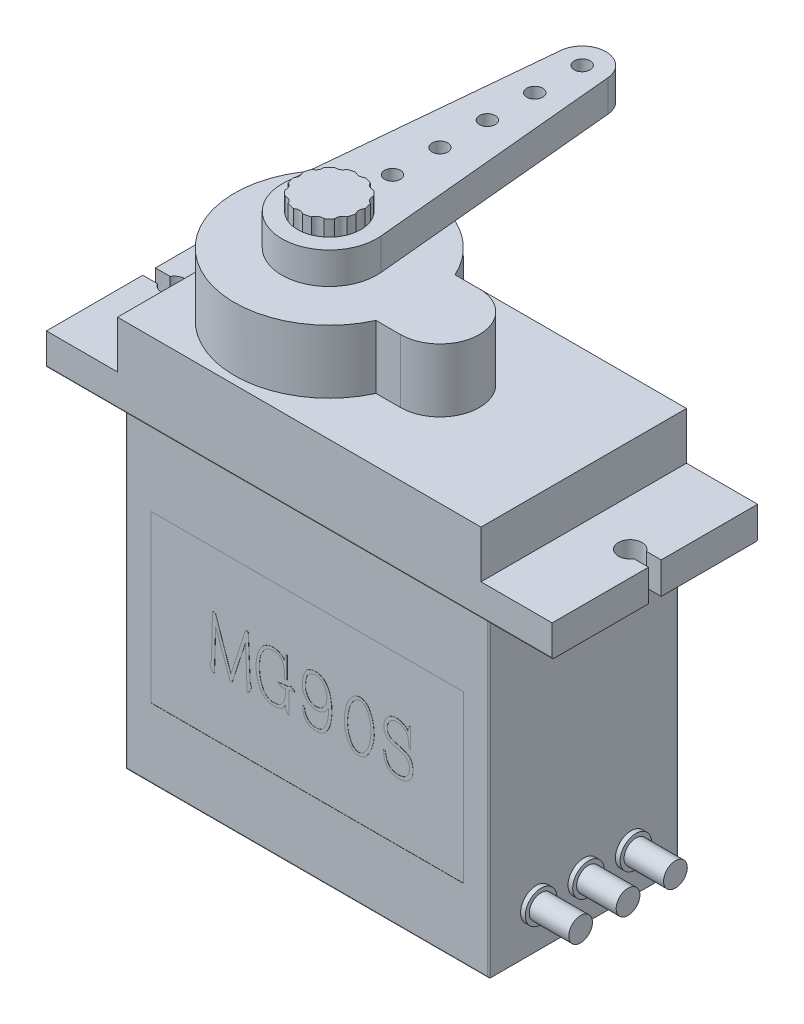
from build123d import *

# Parameters (mm, degrees)
SKETCH_1_W               = 23
SKETCH_1_H               = 12
EXTRUDE_1_DEPTH          = 20
SKETCH_2_W               = 32
SKETCH_2_H               = 13
EXTRUDE_2_DEPTH          = 2
SKETCH_3_W               = 23
SKETCH_3_H               = 13
EXTRUDE_3_DEPTH          = 3
CUT_EXTRUDE_1_DEPTH      = 5
EXTRUDE_4_DEPTH          = 4
SKETCH_6_R               = 2
EXTRUDE_5_DEPTH          = 3
SKETCH_7_R               = 0.451719516
CUT_EXTRUDE_2_DEPTH      = 3
PATTERN_CIRCULAR_1_COUNT = 12
SKETCH_9_R               = 0.5
SKETCH_9_R_2             = 2
EXTRUDE_6_DEPTH          = 2
FILLET_1_R               = 0.1
SKETCH_10_W              = 19.757808014
SKETCH_10_H              = 10.496335508
CUT_EXTRUDE_3_DEPTH      = 0.01
EXTRUDE_7_DEPTH          = 0.01
EXTRUDE_8_DEPTH          = 0.01
SKETCH_13_R              = 1
EXTRUDE_9_DEPTH          = 0.3
SKETCH_14_R              = 0.75
EXTRUDE_10_DEPTH         = 2.5


with BuildPart() as part:
    # 草图1 → 凸台-拉伸1 (new body)
    with BuildSketch(Plane(origin=(0, 0, 0), x_dir=(1, 0, 0), z_dir=(0, 1, 0))):
        Rectangle(SKETCH_1_W, SKETCH_1_H)
    extrude(amount=EXTRUDE_1_DEPTH)

    # 草图2 → 凸台-拉伸2 (add)
    with BuildSketch(Plane(origin=(0, 20, 0), x_dir=(1, 0, 0), z_dir=(0, 1, 0))):
        Rectangle(SKETCH_2_W, SKETCH_2_H)
    extrude(amount=EXTRUDE_2_DEPTH)

    # 草图3 → 凸台-拉伸3 (add)
    with BuildSketch(Plane(origin=(0, 22, 0), x_dir=(1, 0, 0), z_dir=(0, 1, 0))):
        Rectangle(SKETCH_3_W, SKETCH_3_H)
    extrude(amount=EXTRUDE_3_DEPTH)

    # 草图4 → 切除-拉伸1 (cut)
    with BuildSketch(Plane(origin=(0, 22, 0), x_dir=(1, 0, 0), z_dir=(0, 1, 0))):
        with BuildLine():
            Line((-17.205658095, -0.482422363), (-16, -0.4))
            Line((-16, -0.4), (-15.074338751, -0.4))
            ThreePointArc((-15.074338751, -0.4), (-13.689909874, 0), (-15.074338751, 0.4))
            Line((-15.074338751, 0.4), (-17.205658095, 0.4))
            Line((-17.205658095, 0.4), (-17.205658095, -0.482422363))
        make_face()
        with BuildLine():
            Line((15.074338751, -0.4), (16, -0.4))
            Line((16, -0.4), (17.570379292, -0.559769684))
            Line((17.570379292, -0.559769684), (17.570379292, 0.4))
            Line((17.570379292, 0.4), (15.074338751, 0.4))
            ThreePointArc((15.074338751, 0.4), (13.689909874, 0), (15.074338751, -0.4))
        make_face()
    extrude(amount=-CUT_EXTRUDE_1_DEPTH, mode=Mode.SUBTRACT)

    # 草图5 → 凸台-拉伸4 (add)
    with BuildSketch(Plane(origin=(0, 25, 0), x_dir=(1, 0, 0), z_dir=(0, 1, 0))):
        with BuildLine():
            Line((2.399333462, 2.5), (0.85368952, 2.5))
            ThreePointArc((0.85368952, 2.5), (-10.600666538, 0), (0.85368952, -2.5))
            Line((0.85368952, -2.5), (2.399333462, -2.5))
            ThreePointArc((2.399333462, -2.5), (4.899333462, 0), (2.399333462, 2.5))
        make_face()
    extrude(amount=EXTRUDE_4_DEPTH)

    # 草图6 → 凸台-拉伸5 (add)
    with BuildSketch(Plane(origin=(0, 29, 0), x_dir=(1, 0, 0), z_dir=(0, 1, 0))):
        with Locations((-4.600666538, 0)):
            Circle(SKETCH_6_R)
    extrude(amount=EXTRUDE_5_DEPTH)

    # 草图7 → 切除-拉伸2 (cut)
    with BuildSketch(Plane(origin=(0, 32, 0), x_dir=(1, 0, 0), z_dir=(0, 1, 0))):
        with Locations((-4.601377791, 2.331013471)):
            Circle(SKETCH_7_R)
    cut_extrude_2 = extrude(amount=-CUT_EXTRUDE_2_DEPTH, mode=Mode.SUBTRACT)

    # 阵列(圆周)1: 切除-拉伸2 ×12 about axis
    pattern_circular_1_axis = Axis((-4.600666538, 32, 0), (0, 1, 0))
    for i in range(1, PATTERN_CIRCULAR_1_COUNT):
        add(cut_extrude_2.rotate(pattern_circular_1_axis, i * 360 / PATTERN_CIRCULAR_1_COUNT), mode=Mode.SUBTRACT)

    # 草图9 → 凸台-拉伸6 (add)
    with BuildSketch(Plane(origin=(0, 29, 0), x_dir=(1, 0, 0), z_dir=(0, 1, 0))):
        with BuildLine():
            ThreePointArc((-3.107272882, 16.140625), (-4.600666538, 17.5), (-6.094060193, 16.140625))
            Line((-6.094060193, 16.140625), (-7.587453848, 0.28125))
            ThreePointArc((-7.587453848, 0.28125), (-4.600666538, -3), (-1.613879227, 0.28125))
            Line((-1.613879227, 0.28125), (-3.107272882, 16.140625))
        make_face()
        with Locations((-4.600666538, 7)):
            Circle(SKETCH_9_R, mode=Mode.SUBTRACT)
        with Locations((-4.600666538, 10)):
            Circle(SKETCH_9_R, mode=Mode.SUBTRACT)
        with Locations((-4.600666538, 13)):
            Circle(SKETCH_9_R, mode=Mode.SUBTRACT)
        with Locations((-4.600666538, 16)):
            Circle(SKETCH_9_R, mode=Mode.SUBTRACT)
        with Locations((-4.600666538, 4)):
            Circle(SKETCH_9_R, mode=Mode.SUBTRACT)
        with Locations((-4.600666538, 0)):
            Circle(SKETCH_9_R_2, mode=Mode.SUBTRACT)
    extrude(amount=EXTRUDE_6_DEPTH)

    # 圆角1
    fillet_1_edges = [part.edges().sort_by_distance(p)[0] for p in [
        (11.5, 20, 0),
        (-11.5, 20, 0),
        (-11.5, 10, 6),
        (0, 20, 6),
        (11.5, 10, 6),
        (0, 0, 6),
        (11.5, 10, -6),
        (-11.5, 10, -6),
        (0, 20, -6.5),
        (0, 20, -6),
        (0, 20, 6.5),
    ]]
    fillet(fillet_1_edges, radius=FILLET_1_R)

    # 草图10 → 切除-拉伸3 (cut)
    with BuildSketch(Plane(origin=(0, 0, -6), x_dir=(-1, 0, 0), z_dir=(0, 0, -1))):
        with Locations((0, 9.67132712)):
            Rectangle(SKETCH_10_W, SKETCH_10_H)
    cut_extrude_3 = extrude(amount=-CUT_EXTRUDE_3_DEPTH, mode=Mode.SUBTRACT)

    # 草图11 → 凸台-拉伸7 (add)
    # profile 1 of 5: a face of its own
    with BuildSketch(Plane(origin=(0, 0, -5.99), x_dir=(-1, 0, 0), z_dir=(0, 0, -1))):
        with BuildLine():
            Line((-4.036633201, 11.559579697), (-3.863609549, 11.559579697))
            Line((-3.863609549, 11.559579697), (-3.758452933, 9.198403477))
            Line((-3.758452933, 9.198403477), (-3.750995017, 8.976903371))
            add(Edge.make_bspline(
                [(-3.750995017, 8.976903371), (-3.750810375, 8.963726547), (-3.750465354, 8.939104467), (-3.749059834, 8.905024146), (-3.746864639, 8.876416448), (-3.743121024, 8.844759374), (-3.733055926, 8.807329766), (-3.71813329, 8.762858427), (-3.699830801, 8.720132649), (-3.6784786, 8.684345818), (-3.659687607, 8.658698615), (-3.647517043, 8.637448395), (-3.652758854, 8.616487519), (-3.662962537, 8.591250225), (-3.682302805, 8.554308321), (-3.697534928, 8.525671788), (-3.706247521, 8.509292035)],
                knots=[0, 0, 0, 0, 1.102622065, 2.060348445, 2.85322637, 3.5033872, 4.724253574, 6.08585166, 7.426958976, 8.611308867, 9.540138572, 10.14657179, 10.526145073, 11.283294257, 12.446076872, 14, 14, 14, 14], degree=3))
            Line((-3.706247521, 8.509292035), (-3.789030389, 8.337759965))
            add(Edge.make_bspline(
                [(-3.789030389, 8.337759965), (-3.798276186, 8.322139747), (-3.814618829, 8.294529834), (-3.835437812, 8.257859816), (-3.853079266, 8.234312548), (-3.86801953, 8.217507436), (-3.88447418, 8.210713118), (-3.901220894, 8.207797414), (-3.915645081, 8.214830409), (-3.921142498, 8.223071293), (-3.924018669, 8.227382808)],
                knots=[0, 0, 0, 0, 2.097445621, 3.707393256, 4.855709257, 5.505294883, 6.263205192, 6.868799007, 7.408171479, 8, 8, 8, 8], degree=3))
            add(Edge.make_bspline(
                [(-3.924018669, 8.227382808), (-3.928595028, 8.233362099), (-3.939712751, 8.24788808), (-3.940650095, 8.281887541), (-3.940864971, 8.32572426), (-3.934867828, 8.359138019), (-3.931476585, 8.378032712)],
                knots=[0, 0, 0, 0, 0.57105219, 1.387303892, 2.522581914, 4, 4, 4, 4], degree=3))
            Line((-3.931476585, 8.378032712), (-3.946392417, 8.694994144))
            Line((-3.946392417, 8.694994144), (-4.036633201, 10.874943004))
            Line((-4.036633201, 10.874943004), (-4.877886131, 8.317623592))
            Line((-4.877886131, 8.317623592), (-5.020332328, 8.322844133))
            Line((-5.020332328, 8.322844133), (-5.929452294, 10.84511134))
            Line((-5.929452294, 10.84511134), (-5.989115622, 8.670383021))
            Line((-5.989115622, 8.670383021), (-6.004031454, 8.357896339))
            add(Edge.make_bspline(
                [(-6.004031454, 8.357896339), (-6.004540768, 8.335247358), (-6.00545681, 8.29451133), (-6.014876947, 8.247062432), (-6.026992148, 8.219276784), (-6.034340211, 8.20440647), (-6.04565882, 8.196513169), (-6.053428171, 8.196713637), (-6.056982658, 8.196805352)],
                knots=[0, 0, 0, 0, 2.241788066, 4.032037628, 4.72646647, 5.245360405, 5.654751578, 6, 6, 6, 6], degree=3))
            add(Edge.make_bspline(
                [(-6.056982658, 8.196805352), (-6.061955128, 8.19741298), (-6.07213755, 8.198657255), (-6.090481232, 8.204033505), (-6.1083788, 8.226949001), (-6.122392326, 8.253525393), (-6.133797771, 8.279000111), (-6.140300053, 8.295075333), (-6.145343191, 8.305227064), (-6.146763972, 8.31064948), (-6.147223442, 8.312403051)],
                knots=[0, 0, 0, 0, 0.773742426, 1.584438234, 2.856229669, 5.048713155, 6.264606395, 7.138724284, 7.721469543, 8, 8, 8, 8], degree=3))
            Line((-6.147223442, 8.312403051), (-6.282211723, 8.539123699))
            add(Edge.make_bspline(
                [(-6.282211723, 8.539123699), (-6.285957762, 8.550426718), (-6.293253235, 8.572439536), (-6.29111158, 8.608812919), (-6.27725228, 8.64625847), (-6.256656635, 8.684897351), (-6.236001621, 8.720469814), (-6.219662485, 8.745894155), (-6.21184835, 8.766280496), (-6.206961882, 8.786289421), (-6.202536741, 8.812711257), (-6.19945952, 8.84365987), (-6.196075145, 8.874496947), (-6.192720725, 8.901049413), (-6.191210474, 8.921068257), (-6.188193187, 8.934821055), (-6.187453327, 8.946844597), (-6.18544427, 8.960933343), (-6.185487182, 8.981406276), (-6.183473154, 9.007961303), (-6.182159946, 9.040789219), (-6.180888524, 9.079588956), (-6.178139597, 9.124544125), (-6.17743294, 9.156634402), (-6.177055106, 9.173792354)],
                knots=[0, 0, 0, 0, 1.188248764, 2.314134131, 3.578792243, 5.177300212, 6.71200139, 7.719582076, 8.20231572, 8.899492557, 9.787079071, 10.893937173, 12.025633957, 12.906153587, 13.585171658, 14.041287617, 14.317366422, 14.794895238, 15.470222966, 16.371430529, 17.472346105, 18.773047127, 20.274620618, 22, 22, 22, 22], degree=3))
            Line((-6.177055106, 9.173792354), (-6.124103902, 11.559579697))
            Line((-6.124103902, 11.559579697), (-5.944368126, 11.559579697))
            Line((-5.944368126, 11.559579697), (-4.960668999, 8.710655768))
            Line((-4.960668999, 8.710655768), (-4.036633201, 11.559579697))
        make_face()
    # profile 2 of 5: a face of its own
    with BuildSketch(Plane(origin=(0, 0, -5.99), x_dir=(-1, 0, 0), z_dir=(0, 0, -1))):
        with BuildLine():
            add(Edge.make_bspline(
                [(-1.488263289, 9.651844773), (-1.507446536, 9.64676811), (-1.54191641, 9.637645989), (-1.587114307, 9.623695649), (-1.620668945, 9.61455671), (-1.638678738, 9.6086354), (-1.645625317, 9.606351485)],
                knots=[0, 0, 0, 0, 1.45335447, 2.611494566, 3.464437835, 4, 4, 4, 4], degree=3))
            Line((-1.645625317, 9.606351485), (-1.735866101, 9.576519821))
            Line((-1.735866101, 9.576519821), (-1.946179334, 9.707033351))
            add(Edge.make_bspline(
                [(-1.946179334, 9.707033351), (-1.954076384, 9.710769955), (-1.967686763, 9.717209904), (-1.982824585, 9.728121975), (-1.994286701, 9.735526437), (-1.996390373, 9.746800346), (-1.991149891, 9.756099223), (-1.984422478, 9.766621426), (-1.970456183, 9.773077944), (-1.959867944, 9.776103281), (-1.95363725, 9.777883554)],
                knots=[0, 0, 0, 0, 1.718889333, 2.962465366, 3.764559914, 4.267040512, 5.063058499, 5.802142645, 6.706661403, 8, 8, 8, 8], degree=3))
            Line((-1.95363725, 9.777883554), (-1.773901473, 9.777883554))
            Line((-1.773901473, 9.777883554), (-1.615793653, 9.802494677))
            Line((-1.615793653, 9.802494677), (-1.420396253, 9.827851591))
            add(Edge.make_bspline(
                [(-1.420396253, 9.827851591), (-1.414418659, 9.828252874), (-1.400647238, 9.829177366), (-1.377302182, 9.833388255), (-1.348339157, 9.839112116), (-1.315814979, 9.8478704), (-1.284109563, 9.85732779), (-1.257260084, 9.866934615), (-1.237586369, 9.876416634), (-1.228607988, 9.884864737), (-1.224998852, 9.888260711)],
                knots=[0, 0, 0, 0, 0.693955059, 1.598761758, 2.745942857, 4.1157883, 5.501303404, 6.577146003, 7.428040259, 8, 8, 8, 8], degree=3))
            Line((-1.224998852, 9.888260711), (-1.180251356, 9.93897454))
            Line((-1.180251356, 9.93897454), (-0.955022291, 9.802494677))
            add(Edge.make_bspline(
                [(-0.955022291, 9.802494677), (-0.946575329, 9.795981808), (-0.931341266, 9.784235875), (-0.923793738, 9.759170406), (-0.926072342, 9.737473414), (-0.935841264, 9.730301182), (-0.940106459, 9.727169725)],
                knots=[0, 0, 0, 0, 1.365288393, 2.462292284, 3.328623616, 4, 4, 4, 4], degree=3))
            Line((-0.940106459, 9.727169725), (-0.992311872, 9.721949183))
            Line((-0.992311872, 9.721949183), (-1.277950056, 9.692117519))
            Line((-1.277950056, 9.692117519), (-1.277950056, 8.438441832))
            add(Edge.make_bspline(
                [(-1.277950056, 8.438441832), (-1.277904306, 8.424022656), (-1.27781832, 8.396922112), (-1.278371006, 8.35937617), (-1.280163807, 8.327789885), (-1.281214256, 8.302474348), (-1.283584083, 8.282837617), (-1.285550214, 8.270050189), (-1.287608645, 8.260987014), (-1.300181245, 8.256716441), (-1.315795942, 8.28339303), (-1.342653785, 8.303004128), (-1.366208326, 8.332342352), (-1.378486261, 8.350909268), (-1.383106672, 8.357896339)],
                knots=[0, 0, 0, 0, 1.638884037, 3.080248724, 4.268371612, 5.230757456, 5.970304009, 6.485938962, 6.764234407, 6.91640097, 7.860781051, 9.459216935, 11.043856725, 12, 12, 12, 12], degree=3))
            Line((-1.383106672, 8.357896339), (-1.420396253, 8.423526))
            Line((-1.420396253, 8.423526), (-1.488263289, 8.509292035))
            add(Edge.make_bspline(
                [(-1.488263289, 8.509292035), (-1.49883158, 8.522330157), (-1.517020974, 8.54477045), (-1.523033644, 8.572851442), (-1.525552869, 8.584616987)],
                knots=[0, 0, 0, 0, 1.162027819, 2, 2, 2, 2], degree=3))
            Line((-1.525552869, 8.584616987), (-1.503179121, 8.634585024))
            Line((-1.503179121, 8.634585024), (-1.458431624, 8.815812384))
            add(Edge.make_bspline(
                [(-1.458431624, 8.815812384), (-1.462420251, 8.809106899), (-1.471248251, 8.794265692), (-1.485717931, 8.769320304), (-1.501818337, 8.739191433), (-1.526316284, 8.689847825), (-1.565887981, 8.620798235), (-1.616202708, 8.550741775), (-1.667617976, 8.493742647), (-1.718225441, 8.45459861), (-1.778221947, 8.420104388), (-1.846017245, 8.388960894), (-1.919765419, 8.364616321), (-1.996306681, 8.344404483), (-2.075627421, 8.33281896), (-2.129364393, 8.329659615), (-2.156492566, 8.328064675)],
                knots=[0, 0, 0, 0, 0.360079271, 0.796961126, 1.330798477, 1.936268444, 3.339412474, 4.998611782, 5.907812621, 6.871824435, 7.936350648, 9.096664203, 10.308473441, 11.516147913, 12.746070606, 14, 14, 14, 14], degree=3))
            add(Edge.make_bspline(
                [(-2.156492566, 8.328064675), (-2.206002001, 8.326475103), (-2.304144237, 8.323324106), (-2.448078281, 8.341973174), (-2.58184734, 8.376224826), (-2.685766896, 8.414735342), (-2.761510566, 8.454802505), (-2.815515592, 8.491348444), (-2.86876447, 8.533035656), (-2.920248721, 8.581873746), (-2.970460783, 8.637582242), (-3.019694337, 8.70044782), (-3.067782861, 8.770709818), (-3.115808017, 8.847058194), (-3.159857358, 8.930282034), (-3.201421003, 9.01859755), (-3.237759628, 9.112633344), (-3.26897609, 9.210727399), (-3.296715455, 9.309368223), (-3.317619246, 9.405938207), (-3.335579464, 9.498306236), (-3.351310649, 9.618896398), (-3.362688598, 9.774415754), (-3.36762928, 9.970080426), (-3.359082981, 10.178249559), (-3.338603637, 10.319459796), (-3.328131177, 10.391670044)],
                knots=[0, 0, 0, 0, 1.296855359, 2.57074811, 3.787781636, 4.912091251, 5.466017451, 6.029935376, 6.619226609, 7.236981495, 7.887517941, 8.58368563, 9.328453953, 10.118705756, 10.946721427, 11.795129947, 12.676149277, 13.587054168, 14.492980187, 15.360984792, 16.176441906, 16.958916834, 18.547327364, 20.261686152, 22.088349834, 24, 24, 24, 24], degree=3))
            add(Edge.make_bspline(
                [(-3.328131177, 10.391670044), (-3.31581909, 10.45202616), (-3.290316294, 10.577045551), (-3.243865649, 10.7324403), (-3.194096619, 10.857682886), (-3.149456583, 10.951540101), (-3.096138473, 11.042106902), (-3.037378118, 11.129657356), (-2.97294786, 11.20970154), (-2.904982735, 11.279942595), (-2.83365647, 11.338114557), (-2.759995107, 11.383770491), (-2.687872645, 11.419480156), (-2.621168525, 11.449128785), (-2.559642305, 11.470090722), (-2.484785745, 11.489439683), (-2.390808861, 11.502212721), (-2.315374951, 11.507098156), (-2.276565015, 11.509611659)],
                knots=[0, 0, 0, 0, 1.756577987, 3.638509638, 4.61548601, 5.59861824, 6.599488823, 7.610330996, 8.603638217, 9.526225021, 10.393301585, 11.221559376, 11.992114492, 12.687601253, 13.30198666, 13.843705084, 14.890609439, 16, 16, 16, 16], degree=3))
            add(Edge.make_bspline(
                [(-2.276565015, 11.509611659), (-2.252180086, 11.50927434), (-2.204531864, 11.508615217), (-2.135014813, 11.500785215), (-2.069166166, 11.489050586), (-1.986518102, 11.467198539), (-1.887964964, 11.427533213), (-1.798856914, 11.372240939), (-1.735557125, 11.324244541), (-1.694707509, 11.294204135), (-1.663199132, 11.267376236), (-1.645793693, 11.250161152), (-1.638167401, 11.242618265)],
                knots=[0, 0, 0, 0, 1.028618936, 2.009924478, 2.948285668, 3.849124628, 5.614173047, 7.408045032, 8.255757124, 8.967072662, 9.547417007, 10, 10, 10, 10], degree=3))
            Line((-1.638167401, 11.242618265), (-1.578504073, 11.162072772))
            Line((-1.578504073, 11.162072772), (-1.488263289, 11.51930695))
            Line((-1.488263289, 11.51930695), (-1.398022505, 11.51930695))
            Line((-1.398022505, 11.51930695), (-1.398022505, 10.155254106))
            Line((-1.398022505, 10.155254106), (-1.556130325, 10.150033564))
            add(Edge.make_bspline(
                [(-1.556130325, 10.150033564), (-1.556137885, 10.173899396), (-1.556154107, 10.225111492), (-1.55601579, 10.305403489), (-1.55658713, 10.390782867), (-1.562283933, 10.46407956), (-1.567976386, 10.526005097), (-1.575032314, 10.578648849), (-1.583069569, 10.637878658), (-1.596646294, 10.722658112), (-1.616124247, 10.825469628), (-1.645193506, 10.922043924), (-1.674877721, 10.991423914), (-1.702163435, 11.041047685), (-1.734721332, 11.090264454), (-1.773541969, 11.137112265), (-1.814940062, 11.182118056), (-1.861781199, 11.220063847), (-1.911317914, 11.252730464), (-1.964866401, 11.278746478), (-2.021815077, 11.299836752), (-2.083182261, 11.315106333), (-2.148366403, 11.327527244), (-2.193726559, 11.331056106), (-2.216901686, 11.332859049)],
                knots=[0, 0, 0, 0, 1.029241144, 2.208579955, 3.463150856, 4.709771319, 5.377594929, 6.144895803, 7.000046666, 7.955382695, 9.847738574, 11.509361239, 12.292086789, 13.098108949, 13.94854226, 14.832640167, 15.719917708, 16.580628735, 17.425162074, 18.273836473, 19.142192505, 20.039325767, 20.998264586, 22, 22, 22, 22], degree=3))
            add(Edge.make_bspline(
                [(-2.216901686, 11.332859049), (-2.252233351, 11.33284138), (-2.32064155, 11.332807168), (-2.420518286, 11.320740442), (-2.513483241, 11.298359416), (-2.600823334, 11.267123077), (-2.68201471, 11.224083435), (-2.756882004, 11.167758614), (-2.827715998, 11.100490207), (-2.890292011, 11.020764135), (-2.946811786, 10.935365368), (-2.996512055, 10.84701003), (-3.037754914, 10.756468319), (-3.070193417, 10.66442461), (-3.09499793, 10.572903637), (-3.115229757, 10.483550424), (-3.131440273, 10.396820574), (-3.143443181, 10.28400888), (-3.152866936, 10.145225989), (-3.154362281, 10.034453555), (-3.155107525, 9.979247287)],
                knots=[0, 0, 0, 0, 1.020275372, 1.975429133, 2.898856823, 3.778321679, 4.649207623, 5.5428454, 6.477686036, 7.463807088, 8.46395691, 9.43518281, 10.389958323, 11.335119297, 12.251816784, 13.128372464, 13.982265046, 14.799347214, 16.404873034, 18, 18, 18, 18], degree=3))
            add(Edge.make_bspline(
                [(-3.155107525, 9.979247287), (-3.154736213, 9.943434389), (-3.153977343, 9.870241693), (-3.145660501, 9.75886105), (-3.134943805, 9.64335622), (-3.118524559, 9.526208335), (-3.098490676, 9.410277478), (-3.072270654, 9.300049283), (-3.042012029, 9.196828795), (-3.006743913, 9.101783577), (-2.969868872, 9.014924673), (-2.931744782, 8.93752908), (-2.894521926, 8.869134605), (-2.857140454, 8.809220958), (-2.81761648, 8.75714602), (-2.77690995, 8.710272948), (-2.732294373, 8.670340958), (-2.672896887, 8.622862812), (-2.593755358, 8.576700647), (-2.494788403, 8.534062762), (-2.388530718, 8.507174727), (-2.314755448, 8.501690112), (-2.276565015, 8.498850952)],
                knots=[0, 0, 0, 0, 1.12696858, 2.303244776, 3.513916033, 4.777610792, 6.025436372, 7.215399533, 8.341824734, 9.408739739, 10.404294378, 11.310616954, 12.123044447, 12.854580355, 13.530616622, 14.179104476, 14.804915579, 15.412257997, 16.570306414, 17.674777253, 18.796327487, 20, 20, 20, 20], degree=3))
            add(Edge.make_bspline(
                [(-2.276565015, 8.498850952), (-2.241480341, 8.498556033), (-2.171029821, 8.497963831), (-2.066100507, 8.511427877), (-1.964711442, 8.538330765), (-1.869641126, 8.581472676), (-1.783207263, 8.640940475), (-1.707172681, 8.71593739), (-1.643551103, 8.80295946), (-1.59884377, 8.900925999), (-1.566657385, 9.001997114), (-1.544191666, 9.104161298), (-1.527950384, 9.203204397), (-1.513621224, 9.299856327), (-1.50307415, 9.398133841), (-1.498241514, 9.465379322), (-1.495721205, 9.500449077)],
                knots=[0, 0, 0, 0, 1.012516189, 2.033146837, 3.045153712, 4.0315948, 5.03338675, 6.059031203, 7.103232184, 8.12782049, 9.154168437, 10.162730715, 11.14603093, 12.052819228, 12.984509442, 14, 14, 14, 14], degree=3))
            Line((-1.495721205, 9.500449077), (-1.488263289, 9.651844773))
        make_face()
    # profile 3 of 5: a face of its own
    with BuildSketch(Plane(origin=(0, 0, -5.99), x_dir=(-1, 0, 0), z_dir=(0, 0, -1))):
        with BuildLine():
            Line((-0.407611254, 9.254337847), (-0.302454637, 9.254337847))
            add(Edge.make_bspline(
                [(-0.302454637, 9.254337847), (-0.299359797, 9.223007248), (-0.293279587, 9.161454263), (-0.281654113, 9.068234595), (-0.257677723, 8.972511572), (-0.230511269, 8.889058169), (-0.20054972, 8.818962561), (-0.168100643, 8.76665171), (-0.130449677, 8.714148813), (-0.084909926, 8.664215785), (-0.034737107, 8.616560359), (0.020521867, 8.573693497), (0.080860099, 8.537608712), (0.143952799, 8.504681858), (0.211918857, 8.480212594), (0.283315228, 8.464053238), (0.357545634, 8.454500701), (0.433269586, 8.455585974), (0.507101521, 8.460938968), (0.575550894, 8.472419287), (0.637312441, 8.486599438), (0.693283735, 8.50750043), (0.746918641, 8.536264787), (0.800122323, 8.575654881), (0.855532338, 8.624757581), (0.912732426, 8.683096926), (0.968088756, 8.7515642), (1.018477371, 8.829981042), (1.062375303, 8.917601567), (1.099463117, 9.013928117), (1.133520914, 9.116515369), (1.160009316, 9.225243479), (1.184256856, 9.338447917), (1.194395547, 9.416082238), (1.199569654, 9.455701581)],
                knots=[0, 0, 0, 0, 1.16162944, 2.282170186, 3.461047156, 4.795046393, 5.517605873, 6.266232455, 7.060482654, 7.89822587, 8.754585118, 9.611189846, 10.471517257, 11.345086102, 12.23278881, 13.127051626, 14.041586231, 14.986158028, 15.915289618, 16.770125312, 17.544158719, 18.249341483, 18.96734734, 19.781828795, 20.685074701, 21.696754408, 22.792401261, 23.926927165, 25.12859074, 26.400695433, 27.731823102, 29.113056724, 30.52669809, 32, 32, 32, 32], degree=3))
            Line((1.199569654, 9.455701581), (1.214485486, 9.752526639))
            Line((1.214485486, 9.752526639), (1.221943402, 9.948669831))
            add(Edge.make_bspline(
                [(1.221943402, 9.948669831), (1.211463333, 9.928663747), (1.191622539, 9.890788369), (1.160250313, 9.838815306), (1.133465914, 9.792254826), (1.098197843, 9.739951403), (1.04905563, 9.679381824), (0.990460614, 9.624502321), (0.934697865, 9.58262828), (0.886137094, 9.550937625), (0.830521436, 9.522110938), (0.770540015, 9.491023108), (0.702703987, 9.465722816), (0.627081869, 9.447897455), (0.544049263, 9.437709976), (0.486124458, 9.436298754), (0.456015424, 9.435565207)],
                knots=[0, 0, 0, 0, 0.968176938, 1.832945767, 2.602604043, 3.270786541, 4.536088458, 5.938830683, 6.699952195, 7.524909055, 8.421610756, 9.38460961, 10.420159577, 11.516422693, 12.709048514, 14, 14, 14, 14], degree=3))
            add(Edge.make_bspline(
                [(0.456015424, 9.435565207), (0.412175778, 9.435700539), (0.326296967, 9.435965644), (0.220716408, 9.4557161), (0.14120757, 9.481770015), (0.082857967, 9.505734034), (0.026394011, 9.53577359), (-0.029170592, 9.570893712), (-0.083289153, 9.612363055), (-0.136002669, 9.6603761), (-0.188754545, 9.714297194), (-0.238967896, 9.774640589), (-0.286667156, 9.838198756), (-0.326889732, 9.905625193), (-0.362156346, 9.973510727), (-0.390550396, 10.044343023), (-0.411099738, 10.119245343), (-0.4271271, 10.199171642), (-0.435659424, 10.285577371), (-0.438935684, 10.407842534), (-0.433374628, 10.562211946), (-0.416102177, 10.68437542), (-0.407611254, 10.744429473)],
                knots=[0, 0, 0, 0, 1.441705044, 2.824199658, 3.512860584, 4.195509877, 4.898617788, 5.616302121, 6.358050589, 7.140602836, 7.962709084, 8.840067466, 9.724274371, 10.57652252, 11.422297405, 12.241708885, 13.083989802, 13.976683476, 14.92327147, 15.938956514, 18.003641239, 20, 20, 20, 20], degree=3))
            add(Edge.make_bspline(
                [(-0.407611254, 10.744429473), (-0.402678138, 10.774127477), (-0.392374995, 10.836153744), (-0.365175641, 10.931210398), (-0.329158306, 11.032495342), (-0.29271061, 11.119790235), (-0.258129825, 11.189376895), (-0.228169731, 11.238024618), (-0.195364124, 11.282345978), (-0.159346117, 11.321710369), (-0.121427849, 11.357695703), (-0.078988991, 11.386867078), (-0.035081519, 11.414053518), (0.027437544, 11.439821005), (0.102439611, 11.466268199), (0.1857091, 11.493104783), (0.259988977, 11.511147007), (0.306790411, 11.516722465), (0.32848506, 11.51930695)],
                knots=[0, 0, 0, 0, 1.232757082, 2.574695587, 4.043839993, 5.636908344, 6.447822108, 7.225286993, 7.975029676, 8.70343098, 9.409919902, 10.110953229, 10.809762696, 11.521373821, 12.874708382, 14.07002792, 15.105367886, 16, 16, 16, 16], degree=3))
            add(Edge.make_bspline(
                [(0.32848506, 11.51930695), (0.364321316, 11.51996495), (0.437290657, 11.52130476), (0.529816173, 11.508622386), (0.607405309, 11.491454242), (0.670701792, 11.470638616), (0.738950846, 11.44467642), (0.810066369, 11.411475), (0.881478733, 11.372458115), (0.948674723, 11.325396181), (1.008448456, 11.269614443), (1.0787465, 11.187163907), (1.154978996, 11.078576457), (1.223623681, 10.965227951), (1.270367744, 10.866186313), (1.300196545, 10.777955812), (1.327826642, 10.67663802), (1.349651027, 10.566151172), (1.369316726, 10.457590134), (1.3870505, 10.360766308), (1.399221685, 10.280055791), (1.413147485, 10.193119744), (1.423202846, 10.088596124), (1.428965786, 9.962900173), (1.431790102, 9.840792559), (1.432110665, 9.762720165), (1.432256635, 9.727169725)],
                knots=[0, 0, 0, 0, 1.082314526, 2.203795405, 2.812768196, 3.48307452, 4.215864342, 5.019537785, 5.853937194, 6.673479638, 7.492539451, 8.318364637, 9.945203696, 11.498449629, 12.318922061, 13.250710799, 14.310025034, 15.492196224, 16.653833176, 17.64607324, 18.467784017, 19.121493808, 20.307600611, 21.6396321, 22.925201183, 24, 24, 24, 24], degree=3))
            add(Edge.make_bspline(
                [(1.432256635, 9.727169725), (1.42724998, 9.667708267), (1.417679145, 9.554040381), (1.396595859, 9.391094438), (1.371114612, 9.240488859), (1.340339537, 9.098673622), (1.299853024, 8.961767714), (1.255141831, 8.851380825), (1.211729865, 8.763111234), (1.17106185, 8.696553338), (1.124839216, 8.628339211), (1.072794055, 8.561387031), (1.018259252, 8.497468548), (0.958289093, 8.444863528), (0.899268091, 8.399434168), (0.83712775, 8.367375984), (0.776662113, 8.341652804), (0.717592895, 8.323130896), (0.661777961, 8.306282066), (0.590653654, 8.2943888), (0.504951481, 8.28581664), (0.43714152, 8.287140965), (0.403810012, 8.287791928)],
                knots=[0, 0, 0, 0, 1.796464166, 3.434162059, 4.94524942, 6.394412382, 7.801024072, 9.238210998, 9.974631968, 10.760230082, 11.584423879, 12.454256644, 13.313298509, 14.108324846, 14.852352226, 15.548894396, 16.206420075, 16.828931543, 17.411892771, 17.959522592, 18.997017705, 20, 20, 20, 20], degree=3))
            add(Edge.make_bspline(
                [(0.403810012, 8.287791928), (0.374196488, 8.289104345), (0.316018558, 8.291682685), (0.230393351, 8.302834645), (0.148320465, 8.321196576), (0.069427123, 8.343668347), (-0.004684149, 8.372815763), (-0.071434427, 8.411280177), (-0.133408002, 8.453789625), (-0.18738248, 8.505546254), (-0.235118186, 8.563453046), (-0.278192928, 8.62710732), (-0.314261729, 8.697778581), (-0.346235292, 8.774039773), (-0.370247414, 8.857783773), (-0.389971942, 8.948115738), (-0.402334928, 9.045963518), (-0.405817571, 9.1136002), (-0.407611254, 9.14843544)],
                knots=[0, 0, 0, 0, 1.06180009, 2.085983817, 3.088835791, 4.072557444, 5.023637756, 5.932923572, 6.827563455, 7.70970027, 8.601542247, 9.513137391, 10.457352421, 11.439903912, 12.47138224, 13.573765412, 14.750404941, 16, 16, 16, 16], degree=3))
            Line((-0.407611254, 9.14843544), (-0.407611254, 9.254337847))
        make_face()
        with BuildLine():
            add(Edge.make_bspline(
                [(1.116786786, 10.472215538), (1.11516282, 10.517607682), (1.111883462, 10.609270357), (1.08676296, 10.722663072), (1.058565457, 10.813238775), (1.03088622, 10.882203365), (0.99620827, 10.950739453), (0.956274039, 11.019013441), (0.910829253, 11.085312679), (0.857715522, 11.146112921), (0.797087446, 11.199934674), (0.73127675, 11.248847936), (0.657929051, 11.288962804), (0.576851716, 11.316880617), (0.488636976, 11.331608032), (0.427727642, 11.332433721), (0.396352096, 11.332859049)],
                knots=[0, 0, 0, 0, 1.52274826, 3.074963318, 3.880291605, 4.708153294, 5.5668852, 6.457491774, 7.363038221, 8.262289773, 9.16084348, 10.080935796, 11.011086123, 11.956288705, 12.947245796, 14, 14, 14, 14], degree=3))
            add(Edge.make_bspline(
                [(0.396352096, 11.332859049), (0.367900437, 11.331210777), (0.311403023, 11.327937747), (0.228572532, 11.308148619), (0.14810018, 11.279361459), (0.072779743, 11.239105066), (0.004232686, 11.193208589), (-0.054405055, 11.142368952), (-0.100301922, 11.086632256), (-0.135729246, 11.026819435), (-0.161018759, 10.962003776), (-0.183718072, 10.893097545), (-0.202226303, 10.818281326), (-0.221065596, 10.713055125), (-0.238091051, 10.582758428), (-0.250101728, 10.454583383), (-0.250576414, 10.353521252), (-0.238998298, 10.275372684), (-0.220035081, 10.193011167), (-0.200142715, 10.138166068), (-0.189840105, 10.109760818)],
                knots=[0, 0, 0, 0, 0.972772912, 1.931667861, 2.899749813, 3.888327429, 4.843182364, 5.716415293, 6.531617279, 7.301366152, 8.082760904, 8.90533085, 9.781537621, 10.715195571, 12.559343609, 14.273339594, 15.114927498, 16.006948823, 16.967763408, 18, 18, 18, 18], degree=3))
            add(Edge.make_bspline(
                [(-0.189840105, 10.109760818), (-0.181324977, 10.085724014), (-0.164229359, 10.037465901), (-0.130372894, 9.967498259), (-0.088273918, 9.900734981), (-0.040755042, 9.836996436), (0.012567716, 9.780625552), (0.067350623, 9.731111676), (0.125573267, 9.693043162), (0.184981359, 9.663106852), (0.247529544, 9.643121056), (0.31199889, 9.629724447), (0.379599817, 9.623387427), (0.425185274, 9.625437011), (0.448557508, 9.626487858)],
                knots=[0, 0, 0, 0, 1.058290889, 2.124705239, 3.218833526, 4.331549011, 5.419672131, 6.436320184, 7.389636216, 8.299024177, 9.190127251, 10.107157016, 11.029515701, 12, 12, 12, 12], degree=3))
            add(Edge.make_bspline(
                [(0.448557508, 9.626487858), (0.476481219, 9.628025101), (0.531016065, 9.631027328), (0.609579714, 9.647167277), (0.682639427, 9.670760142), (0.749085587, 9.703280773), (0.808658602, 9.7409043), (0.861357813, 9.781622611), (0.907284042, 9.823688748), (0.945788399, 9.870080226), (0.978769912, 9.921409711), (1.01000896, 9.977926354), (1.039271708, 10.04118392), (1.066051684, 10.111308394), (1.089871495, 10.189237586), (1.105598528, 10.276043144), (1.11546279, 10.37130225), (1.116333062, 10.437633255), (1.116786786, 10.472215538)],
                knots=[0, 0, 0, 0, 1.109936298, 2.167699197, 3.176689435, 4.153093644, 5.098628416, 5.97195089, 6.796656123, 7.568176282, 8.359982535, 9.217746967, 10.132597333, 11.12692598, 12.198938107, 13.365247432, 14.626347409, 16, 16, 16, 16], degree=3))
        make_face(mode=Mode.SUBTRACT)
    # profile 4 of 5: a face of its own
    with BuildSketch(Plane(origin=(0, 0, -5.99), x_dir=(-1, 0, 0), z_dir=(0, 0, -1))):
        with BuildLine():
            add(Edge.make_bspline(
                [(2.228016277, 9.959110914), (2.23148557, 10.007388764), (2.238604681, 10.106456592), (2.259444969, 10.257969042), (2.287842853, 10.416254923), (2.324091426, 10.57872945), (2.370628174, 10.740219305), (2.434270625, 10.892750841), (2.51220181, 11.034130128), (2.58885617, 11.141702395), (2.654620338, 11.219850046), (2.7021819, 11.273041256), (2.748729641, 11.320039397), (2.79287339, 11.362114142), (2.836683439, 11.397170571), (2.878282598, 11.42757763), (2.919116151, 11.451375951), (2.970671707, 11.474958348), (3.033039752, 11.495921394), (3.105331209, 11.514110191), (3.174603305, 11.524671779), (3.219638286, 11.524574713), (3.241547067, 11.524527492)],
                knots=[0, 0, 0, 0, 1.421834467, 2.917653763, 4.490832608, 6.145868572, 7.807467695, 9.421705623, 10.991013569, 12.541475934, 13.293387457, 13.991583023, 14.637213741, 15.23669597, 15.781976254, 16.284644117, 16.749425969, 17.167749404, 17.948518084, 18.678394462, 19.357060542, 20, 20, 20, 20], degree=3))
            add(Edge.make_bspline(
                [(3.241547067, 11.524527492), (3.262286029, 11.522094962), (3.305581835, 11.51701668), (3.371207528, 11.497794762), (3.440793877, 11.47237161), (3.513880049, 11.439485905), (3.586962749, 11.394859497), (3.65744059, 11.336950675), (3.720970641, 11.263207514), (3.780388007, 11.179077861), (3.834241484, 11.087273887), (3.88466541, 10.992751812), (3.928318643, 10.895585537), (3.967638828, 10.796457), (4.00168518, 10.693218325), (4.029558284, 10.584211255), (4.053558069, 10.469000237), (4.078899648, 10.307094726), (4.100556716, 10.099384933), (4.103634038, 9.931824957), (4.105173745, 9.847987965)],
                knots=[0, 0, 0, 0, 0.54872048, 1.145539319, 1.793434366, 2.499023763, 3.250877943, 4.040882932, 4.889086547, 5.80410948, 6.748941752, 7.68845764, 8.622558141, 9.550842799, 10.494360127, 11.481473396, 12.510628206, 13.590629478, 15.793814662, 18, 18, 18, 18], degree=3))
            add(Edge.make_bspline(
                [(4.105173745, 9.847987965), (4.098664443, 9.780782453), (4.085258755, 9.642374957), (4.056982594, 9.468335603), (4.02644819, 9.324544445), (3.994374728, 9.214009751), (3.95684134, 9.10147128), (3.911138906, 8.98895865), (3.860780226, 8.877860198), (3.802990904, 8.771586936), (3.739622704, 8.671015115), (3.672032039, 8.577052039), (3.601114678, 8.493255356), (3.527014361, 8.42349752), (3.450284714, 8.369312329), (3.37151175, 8.331749998), (3.294628678, 8.305609545), (3.22105135, 8.289333162), (3.151282553, 8.279932215), (3.106082874, 8.281710071), (3.084185039, 8.282571387)],
                knots=[0, 0, 0, 0, 1.780883747, 3.667670348, 4.64788828, 5.656820147, 6.702057724, 7.776173077, 8.858982311, 9.91834108, 10.96456574, 11.993024339, 12.969681747, 13.856002457, 14.671035123, 15.436570475, 16.14999304, 16.80868687, 17.42284592, 18, 18, 18, 18], degree=3))
            add(Edge.make_bspline(
                [(3.084185039, 8.282571387), (3.063465248, 8.284521162), (3.020263972, 8.288586492), (2.953974468, 8.306008361), (2.884058291, 8.332276034), (2.810792396, 8.367975666), (2.73621807, 8.415552946), (2.664746239, 8.479415301), (2.595087467, 8.556985625), (2.528876377, 8.64808535), (2.46812219, 8.750100322), (2.412842669, 8.859258972), (2.36397307, 8.974458929), (2.323934416, 9.094919372), (2.290716132, 9.21646084), (2.265141276, 9.335958723), (2.247742816, 9.452051347), (2.238699823, 9.564213548), (2.233688345, 9.671445341), (2.2310878, 9.772906869), (2.228443983, 9.868111375), (2.228155328, 9.929526108), (2.228016277, 9.959110914)],
                knots=[0, 0, 0, 0, 0.6070315, 1.265675666, 1.993999098, 2.786360152, 3.642341373, 4.568582745, 5.576231793, 6.682903903, 7.852215045, 9.040734445, 10.254471695, 11.503595666, 12.745438522, 13.933159156, 15.070956285, 16.171441484, 17.21827766, 18.206217225, 19.135896025, 20, 20, 20, 20], degree=3))
        make_face()
        with BuildLine():
            add(Edge.make_bspline(
                [(2.423413677, 9.948669831), (2.422582852, 9.924558871), (2.420818828, 9.87336596), (2.419841144, 9.791789338), (2.422662109, 9.701041071), (2.426403541, 9.602482107), (2.435444026, 9.498949068), (2.449072179, 9.39323596), (2.470477901, 9.287046488), (2.4970139, 9.180920672), (2.529452089, 9.076511851), (2.567902255, 8.975667128), (2.609954414, 8.878336196), (2.657792304, 8.787081203), (2.708987978, 8.704521141), (2.762264489, 8.633198582), (2.819352298, 8.57641714), (2.878608526, 8.533440418), (2.937889859, 8.503216049), (2.99412659, 8.481350335), (3.047396843, 8.466656924), (3.082362048, 8.464724062), (3.099100871, 8.463798747)],
                knots=[0, 0, 0, 0, 0.81662374, 1.733873131, 2.76078637, 3.889496387, 5.071884974, 6.277432236, 7.495338715, 8.736197512, 9.979108919, 11.193463708, 12.387917646, 13.566016605, 14.67740459, 15.673765463, 16.57225729, 17.391996605, 18.140959111, 18.817603536, 19.433953708, 20, 20, 20, 20], degree=3))
            add(Edge.make_bspline(
                [(3.099100871, 8.463798747), (3.114787247, 8.463903616), (3.147862128, 8.464124735), (3.199864008, 8.472785793), (3.255601768, 8.489840781), (3.315892371, 8.51324862), (3.378240409, 8.548582136), (3.440239674, 8.598103847), (3.50241984, 8.660722901), (3.56276583, 8.736009254), (3.62027646, 8.819036245), (3.672392286, 8.906773721), (3.716275031, 8.998052546), (3.765947333, 9.124527037), (3.815883159, 9.289241389), (3.85952094, 9.490984856), (3.888926275, 9.689625046), (3.902215011, 9.851753673), (3.905179993, 9.979984481), (3.903709102, 10.081993263), (3.897506086, 10.191421118), (3.890845607, 10.266891177), (3.887402597, 10.30590401)],
                knots=[0, 0, 0, 0, 0.428388754, 0.90326196, 1.434469023, 2.020064563, 2.668328324, 3.384824662, 4.182583949, 5.076329616, 6.018973059, 6.942133028, 7.863164022, 8.784470807, 10.654777194, 12.561115235, 14.422894053, 16.14097175, 17.00435503, 17.928765047, 18.92931389, 20, 20, 20, 20], degree=3))
            add(Edge.make_bspline(
                [(3.887402597, 10.30590401), (3.882239871, 10.342498172), (3.872199557, 10.413665401), (3.852591046, 10.516075453), (3.831428313, 10.611625468), (3.797243005, 10.729194025), (3.744761695, 10.871049202), (3.675661334, 11.00485797), (3.612756925, 11.105296728), (3.560297911, 11.169770409), (3.505050483, 11.223652068), (3.446582403, 11.265253345), (3.388683304, 11.296815378), (3.334147464, 11.320973113), (3.283255056, 11.337954001), (3.249855994, 11.3415857), (3.234089151, 11.343300132)],
                knots=[0, 0, 0, 0, 1.182606383, 2.299897454, 3.336360431, 4.313403129, 6.216813073, 8.166812388, 9.122433721, 10.004690085, 10.820631185, 11.584604753, 12.29325444, 12.927419485, 13.493662161, 14, 14, 14, 14], degree=3))
            add(Edge.make_bspline(
                [(3.234089151, 11.343300132), (3.217138666, 11.34246916), (3.181709606, 11.340732304), (3.127008574, 11.329523166), (3.068631087, 11.312127074), (3.005616692, 11.287861392), (2.938893572, 11.249378242), (2.870003333, 11.192229772), (2.800069596, 11.114757763), (2.726551331, 11.02143486), (2.657051058, 10.910469465), (2.596454379, 10.78343283), (2.547122934, 10.641600576), (2.507947514, 10.490342707), (2.477246312, 10.338909015), (2.452677033, 10.196855478), (2.434008435, 10.068324866), (2.426806832, 9.986991425), (2.423413677, 9.948669831)],
                knots=[0, 0, 0, 0, 0.464755453, 0.971408738, 1.525707594, 2.134531556, 2.818502877, 3.627570469, 4.577671841, 5.675276596, 6.88188543, 8.15930728, 9.526128642, 10.992633887, 12.44039056, 13.761580684, 14.945331768, 16, 16, 16, 16], degree=3))
        make_face(mode=Mode.SUBTRACT)
    # profile 5 of 5: a face of its own
    with BuildSketch(Plane(origin=(0, 0, -5.99), x_dir=(-1, 0, 0), z_dir=(0, 0, -1))):
        with BuildLine():
            Line((6.253053566, 11.197124977), (6.327632727, 11.504391118))
            Line((6.327632727, 11.504391118), (6.402957679, 11.499170577))
            Line((6.402957679, 11.499170577), (6.402957679, 10.24102014))
            Line((6.402957679, 10.24102014), (6.312716895, 10.235799599))
            Line((6.312716895, 10.235799599), (6.260511482, 10.769040596))
            add(Edge.make_bspline(
                [(6.260511482, 10.769040596), (6.253107211, 10.798703431), (6.239381043, 10.853692909), (6.216116726, 10.928514257), (6.190928303, 10.989022993), (6.155761282, 11.051672008), (6.10181994, 11.118279181), (6.022620791, 11.188071845), (5.927573638, 11.251666977), (5.816397452, 11.300332486), (5.695990174, 11.338313859), (5.611459938, 11.345116676), (5.569162665, 11.348520673)],
                knots=[0, 0, 0, 0, 0.935623271, 1.734474671, 2.395841444, 2.937539833, 3.928539093, 5.000791313, 6.159301743, 7.412365781, 8.705198556, 10, 10, 10, 10], degree=3))
            add(Edge.make_bspline(
                [(5.569162665, 11.348520673), (5.543765304, 11.34780106), (5.491953524, 11.346333015), (5.426669895, 11.336150447), (5.371450311, 11.322799727), (5.326090697, 11.30485502), (5.275911724, 11.281709019), (5.22320553, 11.252750163), (5.170925428, 11.219206323), (5.122707098, 11.181475169), (5.081496519, 11.138470621), (5.036168333, 11.078283497), (4.993150508, 11.000252123), (4.962364727, 10.918863342), (4.950373463, 10.850491445), (4.941582167, 10.793648104), (4.937159704, 10.729556898), (4.933520011, 10.660481163), (4.935554674, 10.588567949), (4.953208552, 10.518898023), (4.979345769, 10.451439099), (5.006957495, 10.411824981), (5.021005836, 10.391670044)],
                knots=[0, 0, 0, 0, 1.132965978, 2.311302488, 2.940940439, 3.664193032, 4.483211672, 5.406698734, 6.345256577, 7.253151702, 8.131906667, 8.995045929, 10.609240802, 12.093583502, 12.850756777, 13.702700875, 14.659956409, 15.714838135, 16.79240312, 17.852638429, 18.907461816, 20, 20, 20, 20], degree=3))
            add(Edge.make_bspline(
                [(5.021005836, 10.391670044), (5.036893941, 10.372538913), (5.068686063, 10.334257494), (5.126095959, 10.285287114), (5.192139125, 10.245569529), (5.263935205, 10.214725285), (5.336888812, 10.19104491), (5.404496092, 10.16832746), (5.466538006, 10.150290994), (5.505749544, 10.140011172), (5.524415169, 10.135117732)],
                knots=[0, 0, 0, 0, 1.033536761, 2.068108508, 3.1219996, 4.229129375, 5.312020342, 6.313102228, 7.196996522, 8, 8, 8, 8], degree=3))
            Line((5.524415169, 10.135117732), (5.786933813, 10.06426753))
            add(Edge.make_bspline(
                [(5.786933813, 10.06426753), (5.819317369, 10.054276923), (5.881378054, 10.035130665), (5.969396878, 10.004462514), (6.048789897, 9.974287414), (6.119548891, 9.94251175), (6.183427937, 9.910459107), (6.241267021, 9.877027207), (6.292799387, 9.841209716), (6.33877891, 9.803406202), (6.380297379, 9.764249398), (6.415845263, 9.720767477), (6.446532892, 9.674201125), (6.47893551, 9.60623032), (6.512158315, 9.516047181), (6.540473463, 9.399907032), (6.557908944, 9.273021332), (6.565117638, 9.160712136), (6.56343965, 9.066752532), (6.557037771, 8.996311617), (6.543731181, 8.927591354), (6.529905161, 8.883319832), (6.523030127, 8.861305672)],
                knots=[0, 0, 0, 0, 1.256679869, 2.408333822, 3.456115853, 4.405283767, 5.283475822, 6.105686116, 6.880587076, 7.607730728, 8.311893935, 8.992987664, 9.685957515, 10.374497826, 11.78046862, 13.242798772, 14.798211721, 16.52516982, 17.410398705, 18.280960291, 19.145201838, 20, 20, 20, 20], degree=3))
            add(Edge.make_bspline(
                [(6.523030127, 8.861305672), (6.514982632, 8.838274719), (6.499043919, 8.792660059), (6.46816107, 8.727423777), (6.431587695, 8.665870494), (6.389154237, 8.609475146), (6.345003027, 8.557696756), (6.300082593, 8.512165223), (6.256067425, 8.472492588), (6.211788966, 8.437439536), (6.163325508, 8.407797417), (6.109183297, 8.381234614), (6.048701297, 8.355501876), (5.981040246, 8.333596171), (5.907178009, 8.314721012), (5.82712661, 8.301336079), (5.74131914, 8.294286933), (5.682286186, 8.292952516), (5.651945533, 8.292266678)],
                knots=[0, 0, 0, 0, 1.044511183, 2.068738664, 3.08602215, 4.106255662, 5.088082775, 5.999276586, 6.843876204, 7.625647373, 8.414710465, 9.271971454, 10.207484414, 11.227884653, 12.315272358, 13.470770177, 14.700073815, 16, 16, 16, 16], degree=3))
            add(Edge.make_bspline(
                [(5.651945533, 8.292266678), (5.617863171, 8.292417448), (5.55126068, 8.292712079), (5.454045511, 8.303136039), (5.362250591, 8.322420699), (5.276410928, 8.350938025), (5.196088707, 8.386948116), (5.121248811, 8.429904676), (5.051022055, 8.478100005), (4.98630851, 8.532838449), (4.928327501, 8.594065453), (4.876371879, 8.660860999), (4.83154413, 8.733327293), (4.794668995, 8.810570357), (4.765409847, 8.889967524), (4.741940727, 8.96853403), (4.726478306, 9.046222377), (4.722444865, 9.097661084), (4.720451819, 9.123078525)],
                knots=[0, 0, 0, 0, 1.178503993, 2.302988938, 3.37577022, 4.417383828, 5.42595166, 6.415866741, 7.398733406, 8.36887536, 9.342176093, 10.310677521, 11.291585681, 12.2840006, 13.266415648, 14.216217261, 15.118578282, 16, 16, 16, 16], degree=3))
            Line((4.720451819, 9.123078525), (4.690620155, 9.390071919))
            Line((4.690620155, 9.390071919), (4.795776771, 9.390071919))
            add(Edge.make_bspline(
                [(4.795776771, 9.390071919), (4.801829209, 9.358467301), (4.81348598, 9.297597979), (4.833016316, 9.209838829), (4.853194315, 9.129102053), (4.878769255, 9.031759332), (4.919349982, 8.921585201), (4.972422835, 8.821124185), (5.024132533, 8.749820342), (5.068219166, 8.700990294), (5.116851448, 8.654982574), (5.170462217, 8.613948592), (5.226143812, 8.576309348), (5.284727715, 8.547079249), (5.343233083, 8.522252724), (5.422106978, 8.500454915), (5.520217379, 8.483716126), (5.598678113, 8.48386322), (5.637029701, 8.48393512)],
                knots=[0, 0, 0, 0, 1.119814336, 2.156720802, 3.12822417, 4.015995167, 5.658396008, 7.202956961, 7.952240773, 8.71812247, 9.489311863, 10.278441639, 11.065482007, 11.823850787, 12.553241916, 13.273390395, 14.667233901, 16, 16, 16, 16], degree=3))
            add(Edge.make_bspline(
                [(5.637029701, 8.48393512), (5.670636687, 8.4847653), (5.73512396, 8.486358304), (5.827342876, 8.499185964), (5.911013813, 8.519433164), (5.985772666, 8.54977245), (6.052591261, 8.587700266), (6.113449866, 8.630820232), (6.167826377, 8.680878938), (6.21542535, 8.736004962), (6.255881119, 8.7939163), (6.28977741, 8.850713441), (6.314716156, 8.906651296), (6.332399412, 8.961696986), (6.343746607, 9.018769267), (6.349820849, 9.079428478), (6.35343702, 9.145194225), (6.35118281, 9.190449261), (6.350006475, 9.214065101)],
                knots=[0, 0, 0, 0, 1.385489548, 2.658567499, 3.832273941, 4.927017625, 5.973653637, 6.995078049, 7.996495518, 9.014053325, 9.992588241, 10.906983086, 11.737710115, 12.512659053, 13.286793684, 14.132569067, 15.025501851, 16, 16, 16, 16], degree=3))
            add(Edge.make_bspline(
                [(6.350006475, 9.214065101), (6.345742339, 9.250960822), (6.337752276, 9.320095367), (6.316085222, 9.415550715), (6.285562928, 9.495180145), (6.247520345, 9.56086439), (6.201635281, 9.614448836), (6.151990239, 9.663020278), (6.096209444, 9.706119083), (6.033529498, 9.743802222), (5.963973026, 9.778147927), (5.886144837, 9.811084992), (5.798675796, 9.841599219), (5.736574038, 9.859025922), (5.704150945, 9.868124338)],
                knots=[0, 0, 0, 0, 1.33594661, 2.503272981, 3.51160173, 4.393751914, 5.219539765, 6.041929097, 6.8900415, 7.749168506, 8.669280216, 9.679432561, 10.788440507, 12, 12, 12, 12], degree=3))
            Line((5.704150945, 9.868124338), (5.381223181, 9.948669831))
            add(Edge.make_bspline(
                [(5.381223181, 9.948669831), (5.330884648, 9.963229318), (5.233350758, 9.991439187), (5.118481887, 10.041420002), (5.03568774, 10.087446825), (4.979855263, 10.124909543), (4.930209233, 10.165912673), (4.88510125, 10.209512493), (4.846445001, 10.257750042), (4.811935499, 10.309374859), (4.781927313, 10.365036026), (4.756301823, 10.424958246), (4.736099024, 10.491050317), (4.725634886, 10.564144454), (4.717835303, 10.64409101), (4.719552428, 10.699661372), (4.720451819, 10.72876785)],
                knots=[0, 0, 0, 0, 1.951939638, 3.781998707, 4.653258759, 5.480846867, 6.284108945, 7.050778814, 7.814924429, 8.583384278, 9.362883311, 10.168387204, 11.009815279, 11.929968449, 12.915765074, 14, 14, 14, 14], degree=3))
            add(Edge.make_bspline(
                [(4.720451819, 10.72876785), (4.72069869, 10.753907382), (4.721176788, 10.802593375), (4.730028103, 10.872823697), (4.741993306, 10.937904631), (4.766560716, 11.017536168), (4.809412707, 11.111205745), (4.875325685, 11.215433656), (4.952751019, 11.308427604), (5.041128167, 11.386219295), (5.141071189, 11.446182592), (5.231987343, 11.487261479), (5.313973795, 11.512207268), (5.384490053, 11.525176717), (5.463112285, 11.532343124), (5.517936416, 11.533574658), (5.546788917, 11.534222782)],
                knots=[0, 0, 0, 0, 0.816395665, 1.581056958, 2.297272649, 2.964362704, 4.284326763, 5.63150742, 6.961865639, 8.204569519, 9.437861136, 10.7364858, 11.436849155, 12.218063841, 13.06221376, 14, 14, 14, 14], degree=3))
            add(Edge.make_bspline(
                [(5.546788917, 11.534222782), (5.578921902, 11.531792986), (5.642289921, 11.527001294), (5.735416011, 11.510274419), (5.825168372, 11.48590891), (5.909804013, 11.452971831), (5.987645368, 11.4162641), (6.05676449, 11.377987947), (6.114795396, 11.337113455), (6.147435427, 11.306845925), (6.162812782, 11.292586303)],
                knots=[0, 0, 0, 0, 1.145413617, 2.258818856, 3.359124546, 4.447717685, 5.483889585, 6.418196088, 7.254781359, 8, 8, 8, 8], degree=3))
            Line((6.162812782, 11.292586303), (6.253053566, 11.197124977))
        make_face()
    extrude(amount=EXTRUDE_7_DEPTH)

    # 镜向1: 切除-拉伸3 across plane
    add(cut_extrude_3.mirror(Plane.XY), mode=Mode.SUBTRACT)

    # 草图12 → 凸台-拉伸8 (add)
    # profile 1 of 5: a face of its own
    with BuildSketch(Plane.XY.offset(5.99)):
        with BuildLine():
            Line((-3.904326451, 11.383170697), (-3.731302799, 11.383170697))
            Line((-3.731302799, 11.383170697), (-3.626146183, 9.021994477))
            Line((-3.626146183, 9.021994477), (-3.618688267, 8.80049437))
            add(Edge.make_bspline(
                [(-3.618688267, 8.80049437), (-3.618503625, 8.787317547), (-3.618158604, 8.762695467), (-3.616753084, 8.728615146), (-3.614557889, 8.700007448), (-3.610814274, 8.668350374), (-3.600749176, 8.630920766), (-3.58582654, 8.586449427), (-3.567524051, 8.543723649), (-3.54617185, 8.507936817), (-3.527380857, 8.482289615), (-3.515210293, 8.461039394), (-3.520452104, 8.440078518), (-3.530655787, 8.414841225), (-3.549996055, 8.377899321), (-3.565228178, 8.349262788), (-3.57394077, 8.332883034)],
                knots=[0, 0, 0, 0, 1.102622065, 2.060348445, 2.85322637, 3.5033872, 4.724253574, 6.08585166, 7.426958976, 8.611308867, 9.540138572, 10.14657179, 10.526145073, 11.283294257, 12.446076872, 14, 14, 14, 14], degree=3))
            Line((-3.57394077, 8.332883034), (-3.656723639, 8.161350965))
            add(Edge.make_bspline(
                [(-3.656723639, 8.161350965), (-3.665969435, 8.145730747), (-3.682312079, 8.118120834), (-3.703131062, 8.081450816), (-3.720772516, 8.057903548), (-3.73571278, 8.041098436), (-3.75216743, 8.034304118), (-3.768914144, 8.031388414), (-3.783338331, 8.038421409), (-3.788835748, 8.046662293), (-3.791711919, 8.050973808)],
                knots=[0, 0, 0, 0, 2.097445621, 3.707393256, 4.855709257, 5.505294883, 6.263205192, 6.868799007, 7.408171479, 8, 8, 8, 8], degree=3))
            add(Edge.make_bspline(
                [(-3.791711919, 8.050973808), (-3.796288278, 8.056953099), (-3.807406001, 8.07147908), (-3.808343345, 8.105478541), (-3.808558221, 8.14931526), (-3.802561078, 8.182729019), (-3.799169835, 8.201623712)],
                knots=[0, 0, 0, 0, 0.57105219, 1.387303892, 2.522581914, 4, 4, 4, 4], degree=3))
            Line((-3.799169835, 8.201623712), (-3.814085667, 8.518585144))
            Line((-3.814085667, 8.518585144), (-3.904326451, 10.698534004))
            Line((-3.904326451, 10.698534004), (-4.745579381, 8.141214592))
            Line((-4.745579381, 8.141214592), (-4.888025578, 8.146435133))
            Line((-4.888025578, 8.146435133), (-5.797145543, 10.66870234))
            Line((-5.797145543, 10.66870234), (-5.856808872, 8.493974021))
            Line((-5.856808872, 8.493974021), (-5.871724704, 8.181487339))
            add(Edge.make_bspline(
                [(-5.871724704, 8.181487339), (-5.872234018, 8.158838358), (-5.87315006, 8.11810233), (-5.882570197, 8.070653432), (-5.894685398, 8.042867784), (-5.902033461, 8.02799747), (-5.91335207, 8.020104168), (-5.921121421, 8.020304637), (-5.924675908, 8.020396352)],
                knots=[0, 0, 0, 0, 2.241788066, 4.032037628, 4.72646647, 5.245360405, 5.654751578, 6, 6, 6, 6], degree=3))
            add(Edge.make_bspline(
                [(-5.924675908, 8.020396352), (-5.929648378, 8.02100398), (-5.9398308, 8.022248255), (-5.958174482, 8.027624504), (-5.97607205, 8.050540001), (-5.990085576, 8.077116393), (-6.001491021, 8.102591111), (-6.007993303, 8.118666333), (-6.013036441, 8.128818063), (-6.014457222, 8.13424048), (-6.014916692, 8.135994051)],
                knots=[0, 0, 0, 0, 0.773742426, 1.584438234, 2.856229669, 5.048713155, 6.264606395, 7.138724284, 7.721469543, 8, 8, 8, 8], degree=3))
            Line((-6.014916692, 8.135994051), (-6.149904972, 8.362714699))
            add(Edge.make_bspline(
                [(-6.149904972, 8.362714699), (-6.153651012, 8.374017718), (-6.160946485, 8.396030536), (-6.15880483, 8.432403919), (-6.14494553, 8.46984947), (-6.124349885, 8.508488351), (-6.103694871, 8.544060814), (-6.087355735, 8.569485154), (-6.0795416, 8.589871496), (-6.074655132, 8.609880421), (-6.070229991, 8.636302257), (-6.06715277, 8.667250869), (-6.063768395, 8.698087947), (-6.060413974, 8.724640413), (-6.058903724, 8.744659257), (-6.055886437, 8.758412055), (-6.055146577, 8.770435597), (-6.05313752, 8.784524343), (-6.053180431, 8.804997276), (-6.051166404, 8.831552303), (-6.049853196, 8.864380219), (-6.048581774, 8.903179956), (-6.045832847, 8.948135124), (-6.04512619, 8.980225402), (-6.044748356, 8.997383354)],
                knots=[0, 0, 0, 0, 1.188248764, 2.314134131, 3.578792243, 5.177300212, 6.71200139, 7.719582076, 8.20231572, 8.899492557, 9.787079071, 10.893937173, 12.025633957, 12.906153587, 13.585171658, 14.041287617, 14.317366422, 14.794895238, 15.470222966, 16.371430529, 17.472346105, 18.773047127, 20.274620618, 22, 22, 22, 22], degree=3))
            Line((-6.044748356, 8.997383354), (-5.991797152, 11.383170697))
            Line((-5.991797152, 11.383170697), (-5.812061376, 11.383170697))
            Line((-5.812061376, 11.383170697), (-4.828362249, 8.534246768))
            Line((-4.828362249, 8.534246768), (-3.904326451, 11.383170697))
        make_face()
    # profile 2 of 5: a face of its own
    with BuildSketch(Plane.XY.offset(5.99)):
        with BuildLine():
            add(Edge.make_bspline(
                [(-1.355956539, 9.475435773), (-1.375139786, 9.47035911), (-1.40960966, 9.461236989), (-1.454807557, 9.447286649), (-1.488362195, 9.43814771), (-1.506371988, 9.4322264), (-1.513318567, 9.429942485)],
                knots=[0, 0, 0, 0, 1.45335447, 2.611494566, 3.464437835, 4, 4, 4, 4], degree=3))
            Line((-1.513318567, 9.429942485), (-1.603559351, 9.40011082))
            Line((-1.603559351, 9.40011082), (-1.813872584, 9.530624351))
            add(Edge.make_bspline(
                [(-1.813872584, 9.530624351), (-1.821769633, 9.534360955), (-1.835380013, 9.540800904), (-1.850517835, 9.551712975), (-1.861979951, 9.559117437), (-1.864083623, 9.570391346), (-1.858843141, 9.579690223), (-1.852115728, 9.590212426), (-1.838149432, 9.596668943), (-1.827561194, 9.599694281), (-1.8213305, 9.601474554)],
                knots=[0, 0, 0, 0, 1.718889333, 2.962465366, 3.764559914, 4.267040512, 5.063058499, 5.802142645, 6.706661403, 8, 8, 8, 8], degree=3))
            Line((-1.8213305, 9.601474554), (-1.641594723, 9.601474554))
            Line((-1.641594723, 9.601474554), (-1.483486903, 9.626085677))
            Line((-1.483486903, 9.626085677), (-1.288089503, 9.651442591))
            add(Edge.make_bspline(
                [(-1.288089503, 9.651442591), (-1.282111909, 9.651843874), (-1.268340487, 9.652768366), (-1.244995432, 9.656979255), (-1.216032406, 9.662703116), (-1.183508228, 9.6714614), (-1.151802813, 9.68091879), (-1.124953334, 9.690525615), (-1.105279619, 9.700007634), (-1.096301238, 9.708455737), (-1.092692102, 9.711851711)],
                knots=[0, 0, 0, 0, 0.693955059, 1.598761758, 2.745942857, 4.1157883, 5.501303404, 6.577146003, 7.428040259, 8, 8, 8, 8], degree=3))
            Line((-1.092692102, 9.711851711), (-1.047944606, 9.76256554))
            Line((-1.047944606, 9.76256554), (-0.822715541, 9.626085677))
            add(Edge.make_bspline(
                [(-0.822715541, 9.626085677), (-0.814268579, 9.619572808), (-0.799034516, 9.607826875), (-0.791486988, 9.582761405), (-0.793765592, 9.561064414), (-0.803534514, 9.553892182), (-0.807799709, 9.550760725)],
                knots=[0, 0, 0, 0, 1.365288393, 2.462292284, 3.328623616, 4, 4, 4, 4], degree=3))
            Line((-0.807799709, 9.550760725), (-0.860005122, 9.545540183))
            Line((-0.860005122, 9.545540183), (-1.145643306, 9.515708519))
            Line((-1.145643306, 9.515708519), (-1.145643306, 8.262032832))
            add(Edge.make_bspline(
                [(-1.145643306, 8.262032832), (-1.145597556, 8.247613656), (-1.145511569, 8.220513112), (-1.146064256, 8.182967169), (-1.147857057, 8.151380885), (-1.148907506, 8.126065348), (-1.151277333, 8.106428617), (-1.153243464, 8.093641189), (-1.155301895, 8.084578014), (-1.167874495, 8.080307441), (-1.183489192, 8.10698403), (-1.210347035, 8.126595128), (-1.233901576, 8.155933352), (-1.24617951, 8.174500268), (-1.250799922, 8.181487339)],
                knots=[0, 0, 0, 0, 1.638884037, 3.080248724, 4.268371612, 5.230757456, 5.970304009, 6.485938962, 6.764234407, 6.91640097, 7.860781051, 9.459216935, 11.043856725, 12, 12, 12, 12], degree=3))
            Line((-1.250799922, 8.181487339), (-1.288089503, 8.247117))
            Line((-1.288089503, 8.247117), (-1.355956539, 8.332883034))
            add(Edge.make_bspline(
                [(-1.355956539, 8.332883034), (-1.36652483, 8.345921157), (-1.384714224, 8.36836145), (-1.390726894, 8.396442442), (-1.393246119, 8.408207986)],
                knots=[0, 0, 0, 0, 1.162027819, 2, 2, 2, 2], degree=3))
            Line((-1.393246119, 8.408207986), (-1.370872371, 8.458176024))
            Line((-1.370872371, 8.458176024), (-1.326124874, 8.639403384))
            add(Edge.make_bspline(
                [(-1.326124874, 8.639403384), (-1.3301135, 8.632697899), (-1.338941501, 8.617856692), (-1.353411181, 8.592911304), (-1.369511587, 8.562782433), (-1.394009534, 8.513438825), (-1.433581231, 8.444389234), (-1.483895958, 8.374332774), (-1.535311226, 8.317333647), (-1.585918691, 8.27818961), (-1.645915196, 8.243695388), (-1.713710495, 8.212551894), (-1.787458669, 8.188207321), (-1.863999931, 8.167995483), (-1.943320671, 8.15640996), (-1.997057643, 8.153250615), (-2.024185816, 8.151655674)],
                knots=[0, 0, 0, 0, 0.360079271, 0.796961126, 1.330798477, 1.936268444, 3.339412474, 4.998611782, 5.907812621, 6.871824435, 7.936350648, 9.096664203, 10.308473441, 11.516147913, 12.746070606, 14, 14, 14, 14], degree=3))
            add(Edge.make_bspline(
                [(-2.024185816, 8.151655674), (-2.073695251, 8.150066103), (-2.171837487, 8.146915106), (-2.315771531, 8.165564174), (-2.44954059, 8.199815826), (-2.553460146, 8.238326342), (-2.629203816, 8.278393505), (-2.683208842, 8.314939444), (-2.73645772, 8.356626655), (-2.787941971, 8.405464746), (-2.838154033, 8.461173242), (-2.887387587, 8.52403882), (-2.935476111, 8.594300818), (-2.983501267, 8.670649193), (-3.027550608, 8.753873034), (-3.069114253, 8.84218855), (-3.105452878, 8.936224343), (-3.13666934, 9.034318399), (-3.164408705, 9.132959223), (-3.185312496, 9.229529207), (-3.203272713, 9.321897236), (-3.219003899, 9.442487398), (-3.230381847, 9.598006754), (-3.23532253, 9.793671425), (-3.226776231, 10.001840559), (-3.206296887, 10.143050796), (-3.195824427, 10.215261044)],
                knots=[0, 0, 0, 0, 1.296855359, 2.57074811, 3.787781636, 4.912091251, 5.466017451, 6.029935376, 6.619226609, 7.236981495, 7.887517941, 8.58368563, 9.328453953, 10.118705756, 10.946721427, 11.795129947, 12.676149277, 13.587054168, 14.492980187, 15.360984792, 16.176441906, 16.958916834, 18.547327364, 20.261686152, 22.088349834, 24, 24, 24, 24], degree=3))
            add(Edge.make_bspline(
                [(-3.195824427, 10.215261044), (-3.183512339, 10.27561716), (-3.158009544, 10.40063655), (-3.111558899, 10.5560313), (-3.061789869, 10.681273885), (-3.017149833, 10.775131101), (-2.963831723, 10.865697901), (-2.905071368, 10.953248356), (-2.84064111, 11.03329254), (-2.772675985, 11.103533595), (-2.70134972, 11.161705557), (-2.627688356, 11.207361491), (-2.555565895, 11.243071156), (-2.488861775, 11.272719785), (-2.427335555, 11.293681721), (-2.352478995, 11.313030683), (-2.258502111, 11.325803721), (-2.183068201, 11.330689156), (-2.144258265, 11.333202659)],
                knots=[0, 0, 0, 0, 1.756577987, 3.638509638, 4.61548601, 5.59861824, 6.599488823, 7.610330996, 8.603638217, 9.526225021, 10.393301585, 11.221559376, 11.992114492, 12.687601253, 13.30198666, 13.843705084, 14.890609439, 16, 16, 16, 16], degree=3))
            add(Edge.make_bspline(
                [(-2.144258265, 11.333202659), (-2.119873336, 11.33286534), (-2.072225114, 11.332206217), (-2.002708063, 11.324376215), (-1.936859416, 11.312641586), (-1.854211352, 11.290789539), (-1.755658214, 11.251124213), (-1.666550164, 11.195831938), (-1.603250375, 11.147835541), (-1.562400759, 11.117795134), (-1.530892382, 11.090967236), (-1.513486943, 11.073752152), (-1.505860651, 11.066209265)],
                knots=[0, 0, 0, 0, 1.028618936, 2.009924478, 2.948285668, 3.849124628, 5.614173047, 7.408045032, 8.255757124, 8.967072662, 9.547417007, 10, 10, 10, 10], degree=3))
            Line((-1.505860651, 11.066209265), (-1.446197323, 10.985663772))
            Line((-1.446197323, 10.985663772), (-1.355956539, 11.34289795))
            Line((-1.355956539, 11.34289795), (-1.265715754, 11.34289795))
            Line((-1.265715754, 11.34289795), (-1.265715754, 9.978845106))
            Line((-1.265715754, 9.978845106), (-1.423823575, 9.973624564))
            add(Edge.make_bspline(
                [(-1.423823575, 9.973624564), (-1.423831135, 9.997490396), (-1.423847357, 10.048702492), (-1.42370904, 10.128994488), (-1.42428038, 10.214373867), (-1.429977183, 10.28767056), (-1.435669635, 10.349596097), (-1.442725564, 10.402239849), (-1.450762819, 10.461469657), (-1.464339544, 10.546249112), (-1.483817497, 10.649060628), (-1.512886756, 10.745634924), (-1.542570971, 10.815014914), (-1.569856685, 10.864638684), (-1.602414582, 10.913855454), (-1.641235218, 10.960703265), (-1.682633312, 11.005709056), (-1.729474449, 11.043654847), (-1.779011164, 11.076321464), (-1.832559651, 11.102337477), (-1.889508327, 11.123427752), (-1.950875511, 11.138697333), (-2.016059653, 11.151118244), (-2.061419809, 11.154647105), (-2.084594936, 11.156450049)],
                knots=[0, 0, 0, 0, 1.029241144, 2.208579955, 3.463150856, 4.709771319, 5.377594929, 6.144895803, 7.000046666, 7.955382695, 9.847738574, 11.509361239, 12.292086789, 13.098108949, 13.94854226, 14.832640167, 15.719917708, 16.580628735, 17.425162074, 18.273836473, 19.142192505, 20.039325767, 20.998264586, 22, 22, 22, 22], degree=3))
            add(Edge.make_bspline(
                [(-2.084594936, 11.156450049), (-2.119926601, 11.156432379), (-2.1883348, 11.156398168), (-2.288211536, 11.144331441), (-2.381176491, 11.121950415), (-2.468516584, 11.090714077), (-2.549707959, 11.047674435), (-2.624575254, 10.991349614), (-2.695409248, 10.924081207), (-2.757985261, 10.844355135), (-2.814505036, 10.758956368), (-2.864205305, 10.67060103), (-2.905448164, 10.580059319), (-2.937886667, 10.48801561), (-2.962691179, 10.396494636), (-2.982923007, 10.307141424), (-2.999133523, 10.220411574), (-3.011136431, 10.10759988), (-3.020560186, 9.968816989), (-3.022055531, 9.858044555), (-3.022800775, 9.802838287)],
                knots=[0, 0, 0, 0, 1.020275372, 1.975429133, 2.898856823, 3.778321679, 4.649207623, 5.5428454, 6.477686036, 7.463807088, 8.46395691, 9.43518281, 10.389958323, 11.335119297, 12.251816784, 13.128372464, 13.982265046, 14.799347214, 16.404873034, 18, 18, 18, 18], degree=3))
            add(Edge.make_bspline(
                [(-3.022800775, 9.802838287), (-3.022429463, 9.767025389), (-3.021670593, 9.693832693), (-3.013353751, 9.582452049), (-3.002637055, 9.466947219), (-2.986217809, 9.349799335), (-2.966183926, 9.233868478), (-2.939963904, 9.123640283), (-2.909705279, 9.020419794), (-2.874437163, 8.925374577), (-2.837562122, 8.838515673), (-2.799438032, 8.76112008), (-2.762215176, 8.692725605), (-2.724833703, 8.632811958), (-2.68530973, 8.58073702), (-2.6446032, 8.533863948), (-2.599987623, 8.493931958), (-2.540590137, 8.446453811), (-2.461448608, 8.400291647), (-2.362481653, 8.357653762), (-2.256223968, 8.330765727), (-2.182448698, 8.325281112), (-2.144258265, 8.322441952)],
                knots=[0, 0, 0, 0, 1.12696858, 2.303244776, 3.513916033, 4.777610792, 6.025436372, 7.215399533, 8.341824734, 9.408739739, 10.404294378, 11.310616954, 12.123044447, 12.854580355, 13.530616622, 14.179104476, 14.804915579, 15.412257997, 16.570306414, 17.674777253, 18.796327487, 20, 20, 20, 20], degree=3))
            add(Edge.make_bspline(
                [(-2.144258265, 8.322441952), (-2.109173591, 8.322147033), (-2.038723071, 8.321554831), (-1.933793757, 8.335018877), (-1.832404692, 8.361921765), (-1.737334376, 8.405063676), (-1.650900513, 8.464531475), (-1.574865931, 8.53952839), (-1.511244353, 8.62655046), (-1.46653702, 8.724516999), (-1.434350635, 8.825588114), (-1.411884916, 8.927752298), (-1.395643634, 9.026795397), (-1.381314474, 9.123447327), (-1.3707674, 9.221724841), (-1.365934763, 9.288970322), (-1.363414455, 9.324040077)],
                knots=[0, 0, 0, 0, 1.012516189, 2.033146837, 3.045153712, 4.0315948, 5.03338675, 6.059031203, 7.103232184, 8.12782049, 9.154168437, 10.162730715, 11.14603093, 12.052819228, 12.984509442, 14, 14, 14, 14], degree=3))
            Line((-1.363414455, 9.324040077), (-1.355956539, 9.475435773))
        make_face()
    # profile 3 of 5: a face of its own
    with BuildSketch(Plane.XY.offset(5.99)):
        with BuildLine():
            Line((-0.275304504, 9.077928847), (-0.170147887, 9.077928847))
            add(Edge.make_bspline(
                [(-0.170147887, 9.077928847), (-0.167053047, 9.046598248), (-0.160972837, 8.985045263), (-0.149347363, 8.891825595), (-0.125370973, 8.796102572), (-0.098204519, 8.712649169), (-0.06824297, 8.64255356), (-0.035793893, 8.59024271), (0.001857073, 8.537739813), (0.047396824, 8.487806785), (0.097569643, 8.440151358), (0.152828617, 8.397284497), (0.213166849, 8.361199712), (0.276259549, 8.328272858), (0.344225607, 8.303803594), (0.415621978, 8.287644238), (0.489852384, 8.278091701), (0.565576337, 8.279176973), (0.639408271, 8.284529967), (0.707857644, 8.296010287), (0.769619191, 8.310190438), (0.825590485, 8.33109143), (0.879225391, 8.359855787), (0.932429073, 8.399245881), (0.987839088, 8.448348581), (1.045039176, 8.506687926), (1.100395506, 8.5751552), (1.150784121, 8.653572041), (1.194682053, 8.741192567), (1.231769867, 8.837519117), (1.265827664, 8.940106368), (1.292316066, 9.048834479), (1.316563606, 9.162038917), (1.326702297, 9.239673238), (1.331876404, 9.279292581)],
                knots=[0, 0, 0, 0, 1.16162944, 2.282170186, 3.461047156, 4.795046393, 5.517605873, 6.266232455, 7.060482654, 7.89822587, 8.754585118, 9.611189846, 10.471517257, 11.345086102, 12.23278881, 13.127051626, 14.041586231, 14.986158028, 15.915289618, 16.770125312, 17.544158719, 18.249341483, 18.96734734, 19.781828795, 20.685074701, 21.696754408, 22.792401261, 23.926927165, 25.12859074, 26.400695433, 27.731823102, 29.113056724, 30.52669809, 32, 32, 32, 32], degree=3))
            Line((1.331876404, 9.279292581), (1.346792236, 9.576117639))
            Line((1.346792236, 9.576117639), (1.354250152, 9.772260831))
            add(Edge.make_bspline(
                [(1.354250152, 9.772260831), (1.343770083, 9.752254747), (1.323929289, 9.714379369), (1.292557063, 9.662406306), (1.265772664, 9.615845826), (1.230504593, 9.563542403), (1.18136238, 9.502972824), (1.122767364, 9.448093321), (1.067004615, 9.40621928), (1.018443844, 9.374528625), (0.962828186, 9.345701938), (0.902846765, 9.314614108), (0.835010737, 9.289313816), (0.759388619, 9.271488455), (0.676356013, 9.261300976), (0.618431208, 9.259889754), (0.588322174, 9.259156207)],
                knots=[0, 0, 0, 0, 0.968176938, 1.832945767, 2.602604043, 3.270786541, 4.536088458, 5.938830683, 6.699952195, 7.524909055, 8.421610756, 9.38460961, 10.420159577, 11.516422693, 12.709048514, 14, 14, 14, 14], degree=3))
            add(Edge.make_bspline(
                [(0.588322174, 9.259156207), (0.544482528, 9.259291539), (0.458603717, 9.259556644), (0.353023158, 9.2793071), (0.273514321, 9.305361015), (0.215164717, 9.329325034), (0.158700761, 9.35936459), (0.103136158, 9.394484711), (0.049017598, 9.435954055), (-0.003695919, 9.4839671), (-0.056447795, 9.537888194), (-0.106661146, 9.598231589), (-0.154360406, 9.661789756), (-0.194582982, 9.729216193), (-0.229849595, 9.797101727), (-0.258243646, 9.867934023), (-0.278792988, 9.942836343), (-0.29482035, 10.022762642), (-0.303352673, 10.109168371), (-0.306628934, 10.231433534), (-0.301067878, 10.385802946), (-0.283795427, 10.50796642), (-0.275304504, 10.568020473)],
                knots=[0, 0, 0, 0, 1.441705044, 2.824199658, 3.512860584, 4.195509877, 4.898617788, 5.616302121, 6.358050589, 7.140602836, 7.962709084, 8.840067466, 9.724274371, 10.57652252, 11.422297405, 12.241708885, 13.083989802, 13.976683476, 14.92327147, 15.938956514, 18.003641239, 20, 20, 20, 20], degree=3))
            add(Edge.make_bspline(
                [(-0.275304504, 10.568020473), (-0.270371388, 10.597718477), (-0.260068245, 10.659744744), (-0.232868891, 10.754801397), (-0.196851556, 10.856086342), (-0.16040386, 10.943381235), (-0.125823075, 11.012967895), (-0.095862981, 11.061615618), (-0.063057374, 11.105936978), (-0.027039366, 11.145301369), (0.010878902, 11.181286703), (0.053317759, 11.210458078), (0.097225231, 11.237644518), (0.159744294, 11.263412005), (0.234746361, 11.289859199), (0.31801585, 11.316695783), (0.392295727, 11.334738007), (0.439097161, 11.340313465), (0.46079181, 11.34289795)],
                knots=[0, 0, 0, 0, 1.232757082, 2.574695587, 4.043839993, 5.636908344, 6.447822108, 7.225286993, 7.975029676, 8.70343098, 9.409919902, 10.110953229, 10.809762696, 11.521373821, 12.874708382, 14.07002792, 15.105367886, 16, 16, 16, 16], degree=3))
            add(Edge.make_bspline(
                [(0.46079181, 11.34289795), (0.496628066, 11.34355595), (0.569597407, 11.34489576), (0.662122923, 11.332213386), (0.73971206, 11.315045242), (0.803008542, 11.294229615), (0.871257596, 11.26826742), (0.942373119, 11.235066), (1.013785483, 11.196049115), (1.080981473, 11.148987181), (1.140755206, 11.093205443), (1.21105325, 11.010754907), (1.287285746, 10.902167457), (1.355930431, 10.788818951), (1.402674494, 10.689777313), (1.432503296, 10.601546812), (1.460133392, 10.50022902), (1.481957777, 10.389742171), (1.501623476, 10.281181134), (1.51935725, 10.184357308), (1.531528435, 10.103646791), (1.545454235, 10.016710744), (1.555509596, 9.912187124), (1.561272536, 9.786491173), (1.564096852, 9.664383559), (1.564417415, 9.586311165), (1.564563385, 9.550760725)],
                knots=[0, 0, 0, 0, 1.082314526, 2.203795405, 2.812768196, 3.48307452, 4.215864342, 5.019537785, 5.853937194, 6.673479638, 7.492539451, 8.318364637, 9.945203696, 11.498449629, 12.318922061, 13.250710799, 14.310025034, 15.492196224, 16.653833176, 17.64607324, 18.467784017, 19.121493808, 20.307600611, 21.6396321, 22.925201183, 24, 24, 24, 24], degree=3))
            add(Edge.make_bspline(
                [(1.564563385, 9.550760725), (1.55955673, 9.491299266), (1.549985895, 9.377631381), (1.528902609, 9.214685438), (1.503421362, 9.064079859), (1.472646287, 8.922264622), (1.432159774, 8.785358714), (1.387448581, 8.674971825), (1.344036615, 8.586702233), (1.3033686, 8.520144338), (1.257145966, 8.451930211), (1.205100805, 8.384978031), (1.150566002, 8.321059548), (1.090595843, 8.268454528), (1.031574841, 8.223025168), (0.9694345, 8.190966983), (0.908968863, 8.165243804), (0.849899645, 8.146721896), (0.794084711, 8.129873065), (0.722960404, 8.1179798), (0.637258231, 8.10940764), (0.56944827, 8.110731965), (0.536116762, 8.111382928)],
                knots=[0, 0, 0, 0, 1.796464166, 3.434162059, 4.94524942, 6.394412382, 7.801024072, 9.238210998, 9.974631968, 10.760230082, 11.584423879, 12.454256644, 13.313298509, 14.108324846, 14.852352226, 15.548894396, 16.206420075, 16.828931543, 17.411892771, 17.959522592, 18.997017705, 20, 20, 20, 20], degree=3))
            add(Edge.make_bspline(
                [(0.536116762, 8.111382928), (0.506503238, 8.112695345), (0.448325308, 8.115273685), (0.362700101, 8.126425645), (0.280627215, 8.144787576), (0.201733873, 8.167259347), (0.127622602, 8.196406762), (0.060872323, 8.234871177), (-0.001101252, 8.277380625), (-0.05507573, 8.329137254), (-0.102811436, 8.387044045), (-0.145886178, 8.45069832), (-0.181954979, 8.521369581), (-0.213928542, 8.597630773), (-0.237940664, 8.681374772), (-0.257665192, 8.771706738), (-0.270028177, 8.869554518), (-0.273510821, 8.9371912), (-0.275304504, 8.972026439)],
                knots=[0, 0, 0, 0, 1.06180009, 2.085983817, 3.088835791, 4.072557444, 5.023637756, 5.932923572, 6.827563455, 7.70970027, 8.601542247, 9.513137391, 10.457352421, 11.439903912, 12.47138224, 13.573765412, 14.750404941, 16, 16, 16, 16], degree=3))
            Line((-0.275304504, 8.972026439), (-0.275304504, 9.077928847))
        make_face()
        with BuildLine():
            add(Edge.make_bspline(
                [(1.249093536, 10.295806537), (1.24746957, 10.341198682), (1.244190212, 10.432861357), (1.21906971, 10.546254072), (1.190872207, 10.636829775), (1.16319297, 10.705794365), (1.128515021, 10.774330453), (1.088580789, 10.842604441), (1.043136003, 10.908903678), (0.990022272, 10.969703921), (0.929394196, 11.023525674), (0.8635835, 11.072438936), (0.790235802, 11.112553804), (0.709158466, 11.140471616), (0.620943726, 11.155199032), (0.560034392, 11.156024721), (0.528658846, 11.156450049)],
                knots=[0, 0, 0, 0, 1.52274826, 3.074963318, 3.880291605, 4.708153294, 5.5668852, 6.457491774, 7.363038221, 8.262289773, 9.16084348, 10.080935796, 11.011086123, 11.956288705, 12.947245796, 14, 14, 14, 14], degree=3))
            add(Edge.make_bspline(
                [(0.528658846, 11.156450049), (0.500207188, 11.154801777), (0.443709773, 11.151528746), (0.360879282, 11.131739619), (0.28040693, 11.102952459), (0.205086493, 11.062696066), (0.136539436, 11.016799589), (0.077901695, 10.965959952), (0.032004828, 10.910223256), (-0.003422496, 10.850410434), (-0.028712009, 10.785594776), (-0.051411322, 10.716688545), (-0.069919553, 10.641872326), (-0.088758846, 10.536646124), (-0.105784301, 10.406349428), (-0.117794978, 10.278174383), (-0.118269664, 10.177112252), (-0.106691548, 10.098963684), (-0.087728331, 10.016602167), (-0.067835965, 9.961757068), (-0.057533355, 9.933351818)],
                knots=[0, 0, 0, 0, 0.972772912, 1.931667861, 2.899749813, 3.888327429, 4.843182364, 5.716415293, 6.531617279, 7.301366152, 8.082760904, 8.90533085, 9.781537621, 10.715195571, 12.559343609, 14.273339594, 15.114927498, 16.006948823, 16.967763408, 18, 18, 18, 18], degree=3))
            add(Edge.make_bspline(
                [(-0.057533355, 9.933351818), (-0.049018227, 9.909315014), (-0.031922609, 9.8610569), (0.001933856, 9.791089259), (0.044032832, 9.724325981), (0.091551708, 9.660587436), (0.144874466, 9.604216552), (0.199657373, 9.554702676), (0.257880017, 9.516634162), (0.317288109, 9.486697852), (0.379836294, 9.466712056), (0.44430564, 9.453315447), (0.511906568, 9.446978427), (0.557492024, 9.449028011), (0.580864258, 9.450078858)],
                knots=[0, 0, 0, 0, 1.058290889, 2.124705239, 3.218833526, 4.331549011, 5.419672131, 6.436320184, 7.389636216, 8.299024177, 9.190127251, 10.107157016, 11.029515701, 12, 12, 12, 12], degree=3))
            add(Edge.make_bspline(
                [(0.580864258, 9.450078858), (0.608787969, 9.451616101), (0.663322815, 9.454618327), (0.741886464, 9.470758277), (0.814946177, 9.494351142), (0.881392337, 9.526871773), (0.940965352, 9.5644953), (0.993664564, 9.60521361), (1.039590792, 9.647279748), (1.078095149, 9.693671226), (1.111076662, 9.745000711), (1.14231571, 9.801517354), (1.171578458, 9.86477492), (1.198358434, 9.934899394), (1.222178245, 10.012828586), (1.237905278, 10.099634143), (1.247769541, 10.19489325), (1.248639812, 10.261224255), (1.249093536, 10.295806537)],
                knots=[0, 0, 0, 0, 1.109936298, 2.167699197, 3.176689435, 4.153093644, 5.098628416, 5.97195089, 6.796656123, 7.568176282, 8.359982535, 9.217746967, 10.132597333, 11.12692598, 12.198938107, 13.365247432, 14.626347409, 16, 16, 16, 16], degree=3))
        make_face(mode=Mode.SUBTRACT)
    # profile 4 of 5: a face of its own
    with BuildSketch(Plane.XY.offset(5.99)):
        with BuildLine():
            add(Edge.make_bspline(
                [(2.360323027, 9.782701914), (2.36379232, 9.830979764), (2.370911431, 9.930047592), (2.391751719, 10.081560041), (2.420149603, 10.239845923), (2.456398176, 10.40232045), (2.502934924, 10.563810305), (2.566577375, 10.716341841), (2.64450856, 10.857721128), (2.72116292, 10.965293395), (2.786927088, 11.043441046), (2.834488651, 11.096632256), (2.881036391, 11.143630397), (2.92518014, 11.185705142), (2.968990189, 11.220761571), (3.010589348, 11.25116863), (3.051422901, 11.27496695), (3.102978457, 11.298549348), (3.165346502, 11.319512394), (3.237637959, 11.337701191), (3.306910055, 11.348262779), (3.351945036, 11.348165713), (3.373853817, 11.348118491)],
                knots=[0, 0, 0, 0, 1.421834467, 2.917653763, 4.490832608, 6.145868572, 7.807467695, 9.421705623, 10.991013569, 12.541475934, 13.293387457, 13.991583023, 14.637213741, 15.23669597, 15.781976254, 16.284644117, 16.749425969, 17.167749404, 17.948518084, 18.678394462, 19.357060542, 20, 20, 20, 20], degree=3))
            add(Edge.make_bspline(
                [(3.373853817, 11.348118491), (3.394592779, 11.345685962), (3.437888585, 11.340607679), (3.503514278, 11.321385762), (3.573100627, 11.295962609), (3.646186799, 11.263076905), (3.719269499, 11.218450497), (3.78974734, 11.160541675), (3.853277391, 11.086798513), (3.912694757, 11.00266886), (3.966548235, 10.910864887), (4.01697216, 10.816342812), (4.060625393, 10.719176537), (4.099945578, 10.620048), (4.133991931, 10.516809325), (4.161865034, 10.407802254), (4.185864819, 10.292591237), (4.211206398, 10.130685726), (4.232863466, 9.922975933), (4.235940788, 9.755415957), (4.237480495, 9.671578964)],
                knots=[0, 0, 0, 0, 0.54872048, 1.145539319, 1.793434366, 2.499023763, 3.250877943, 4.040882932, 4.889086547, 5.80410948, 6.748941752, 7.68845764, 8.622558141, 9.550842799, 10.494360127, 11.481473396, 12.510628206, 13.590629478, 15.793814662, 18, 18, 18, 18], degree=3))
            add(Edge.make_bspline(
                [(4.237480495, 9.671578964), (4.230971194, 9.604373453), (4.217565505, 9.465965956), (4.189289344, 9.291926603), (4.158754941, 9.148135445), (4.126681478, 9.037600751), (4.089148091, 8.92506228), (4.043445656, 8.81254965), (3.993086976, 8.701451198), (3.935297654, 8.595177936), (3.871929454, 8.494606115), (3.80433879, 8.400643039), (3.733421428, 8.316846356), (3.659321111, 8.24708852), (3.582591465, 8.192903329), (3.5038185, 8.155340998), (3.426935428, 8.129200545), (3.3533581, 8.112924162), (3.283589303, 8.103523215), (3.238389624, 8.105301071), (3.216491789, 8.106162387)],
                knots=[0, 0, 0, 0, 1.780883747, 3.667670348, 4.64788828, 5.656820147, 6.702057724, 7.776173077, 8.858982311, 9.91834108, 10.96456574, 11.993024339, 12.969681747, 13.856002457, 14.671035123, 15.436570475, 16.14999304, 16.80868687, 17.42284592, 18, 18, 18, 18], degree=3))
            add(Edge.make_bspline(
                [(3.216491789, 8.106162387), (3.195771998, 8.108112162), (3.152570723, 8.112177492), (3.086281218, 8.129599361), (3.016365041, 8.155867034), (2.943099146, 8.191566666), (2.86852482, 8.239143946), (2.797052989, 8.303006301), (2.727394217, 8.380576624), (2.661183127, 8.471676349), (2.60042894, 8.573691322), (2.545149419, 8.682849972), (2.49627982, 8.798049929), (2.456241166, 8.918510372), (2.423022882, 9.04005184), (2.397448026, 9.159549723), (2.380049566, 9.275642347), (2.371006573, 9.387804548), (2.365995096, 9.495036341), (2.36339455, 9.596497869), (2.360750733, 9.691702374), (2.360462078, 9.753117108), (2.360323027, 9.782701914)],
                knots=[0, 0, 0, 0, 0.6070315, 1.265675666, 1.993999098, 2.786360152, 3.642341373, 4.568582745, 5.576231793, 6.682903903, 7.852215045, 9.040734445, 10.254471695, 11.503595666, 12.745438522, 13.933159156, 15.070956285, 16.171441484, 17.21827766, 18.206217225, 19.135896025, 20, 20, 20, 20], degree=3))
        make_face()
        with BuildLine():
            add(Edge.make_bspline(
                [(2.555720427, 9.772260831), (2.554889603, 9.748149871), (2.553125578, 9.69695696), (2.552147894, 9.615380338), (2.554968859, 9.524632071), (2.558710291, 9.426073107), (2.567750776, 9.322540067), (2.58137893, 9.216826959), (2.602784651, 9.110637488), (2.62932065, 9.004511672), (2.661758839, 8.900102851), (2.700209005, 8.799258128), (2.742261164, 8.701927196), (2.790099054, 8.610672203), (2.841294728, 8.528112141), (2.894571239, 8.456789582), (2.951659048, 8.40000814), (3.010915276, 8.357031418), (3.070196609, 8.326807049), (3.12643334, 8.304941335), (3.179703594, 8.290247924), (3.214668798, 8.288315062), (3.231407621, 8.287389747)],
                knots=[0, 0, 0, 0, 0.81662374, 1.733873131, 2.76078637, 3.889496387, 5.071884974, 6.277432236, 7.495338715, 8.736197512, 9.979108919, 11.193463708, 12.387917646, 13.566016605, 14.67740459, 15.673765463, 16.57225729, 17.391996605, 18.140959111, 18.817603536, 19.433953708, 20, 20, 20, 20], degree=3))
            add(Edge.make_bspline(
                [(3.231407621, 8.287389747), (3.247093997, 8.287494616), (3.280168878, 8.287715735), (3.332170758, 8.296376793), (3.387908518, 8.313431781), (3.448199121, 8.336839619), (3.51054716, 8.372173136), (3.572546424, 8.421694846), (3.63472659, 8.484313901), (3.69507258, 8.559600254), (3.75258321, 8.642627244), (3.804699036, 8.730364721), (3.848581782, 8.821643546), (3.898254083, 8.948118037), (3.94818991, 9.112832389), (3.99182769, 9.314575856), (4.021233026, 9.513216046), (4.034521761, 9.675344673), (4.037486743, 9.80357548), (4.036015852, 9.905584263), (4.029812836, 10.015012118), (4.023152357, 10.090482176), (4.019709347, 10.12949501)],
                knots=[0, 0, 0, 0, 0.428388754, 0.90326196, 1.434469023, 2.020064563, 2.668328324, 3.384824662, 4.182583949, 5.076329616, 6.018973059, 6.942133028, 7.863164022, 8.784470807, 10.654777194, 12.561115235, 14.422894053, 16.14097175, 17.00435503, 17.928765047, 18.92931389, 20, 20, 20, 20], degree=3))
            add(Edge.make_bspline(
                [(4.019709347, 10.12949501), (4.014546621, 10.166089171), (4.004506307, 10.237256401), (3.984897796, 10.339666453), (3.963735063, 10.435216468), (3.929549755, 10.552785025), (3.877068445, 10.694640201), (3.807968084, 10.82844897), (3.745063675, 10.928887728), (3.692604661, 10.993361409), (3.637357233, 11.047243068), (3.578889153, 11.088844345), (3.520990054, 11.120406378), (3.466454214, 11.144564113), (3.415561807, 11.161545001), (3.382162745, 11.165176699), (3.366395901, 11.166891132)],
                knots=[0, 0, 0, 0, 1.182606383, 2.299897454, 3.336360431, 4.313403129, 6.216813073, 8.166812388, 9.122433721, 10.004690085, 10.820631185, 11.584604753, 12.29325444, 12.927419485, 13.493662161, 14, 14, 14, 14], degree=3))
            add(Edge.make_bspline(
                [(3.366395901, 11.166891132), (3.349445417, 11.16606016), (3.314016356, 11.164323304), (3.259315324, 11.153114166), (3.200937837, 11.135718073), (3.137923442, 11.111452391), (3.071200322, 11.072969242), (3.002310083, 11.015820772), (2.932376346, 10.938348763), (2.858858081, 10.84502586), (2.789357809, 10.734060464), (2.728761129, 10.607023829), (2.679429684, 10.465191576), (2.640254264, 10.313933706), (2.609553062, 10.162500015), (2.584983783, 10.020446478), (2.566315185, 9.891915866), (2.559113582, 9.810582425), (2.555720427, 9.772260831)],
                knots=[0, 0, 0, 0, 0.464755453, 0.971408738, 1.525707594, 2.134531556, 2.818502877, 3.627570469, 4.577671841, 5.675276596, 6.88188543, 8.15930728, 9.526128642, 10.992633887, 12.44039056, 13.761580684, 14.945331768, 16, 16, 16, 16], degree=3))
        make_face(mode=Mode.SUBTRACT)
    # profile 5 of 5: a face of its own
    with BuildSketch(Plane.XY.offset(5.99)):
        with BuildLine():
            Line((6.385360316, 11.020715977), (6.459939477, 11.327982118))
            Line((6.459939477, 11.327982118), (6.535264429, 11.322761577))
            Line((6.535264429, 11.322761577), (6.535264429, 10.06461114))
            Line((6.535264429, 10.06461114), (6.445023645, 10.059390599))
            Line((6.445023645, 10.059390599), (6.392818232, 10.592631596))
            add(Edge.make_bspline(
                [(6.392818232, 10.592631596), (6.385413961, 10.622294431), (6.371687793, 10.677283909), (6.348423476, 10.752105257), (6.323235053, 10.812613993), (6.288068033, 10.875263008), (6.23412669, 10.941870181), (6.154927541, 11.011662845), (6.059880388, 11.075257977), (5.948704202, 11.123923486), (5.828296924, 11.161904859), (5.743766688, 11.168707676), (5.701469415, 11.172111673)],
                knots=[0, 0, 0, 0, 0.935623271, 1.734474671, 2.395841444, 2.937539833, 3.928539093, 5.000791313, 6.159301743, 7.412365781, 8.705198556, 10, 10, 10, 10], degree=3))
            add(Edge.make_bspline(
                [(5.701469415, 11.172111673), (5.676072054, 11.171392059), (5.624260274, 11.169924015), (5.558976645, 11.159741447), (5.503757061, 11.146390727), (5.458397447, 11.12844602), (5.408218474, 11.105300019), (5.35551228, 11.076341163), (5.303232178, 11.042797322), (5.255013848, 11.005066169), (5.213803269, 10.962061621), (5.168475083, 10.901874497), (5.125457258, 10.823843123), (5.094671477, 10.742454342), (5.082680213, 10.674082445), (5.073888917, 10.617239104), (5.069466454, 10.553147897), (5.065826761, 10.484072163), (5.067861424, 10.412158949), (5.085515302, 10.342489023), (5.111652519, 10.275030099), (5.139264246, 10.235415981), (5.153312586, 10.215261044)],
                knots=[0, 0, 0, 0, 1.132965978, 2.311302488, 2.940940439, 3.664193032, 4.483211672, 5.406698734, 6.345256577, 7.253151702, 8.131906667, 8.995045929, 10.609240802, 12.093583502, 12.850756777, 13.702700875, 14.659956409, 15.714838135, 16.79240312, 17.852638429, 18.907461816, 20, 20, 20, 20], degree=3))
            add(Edge.make_bspline(
                [(5.153312586, 10.215261044), (5.169200691, 10.196129913), (5.200992813, 10.157848494), (5.25840271, 10.108878114), (5.324445875, 10.069160529), (5.396241955, 10.038316285), (5.469195562, 10.01463591), (5.536802842, 9.99191846), (5.598844756, 9.973881994), (5.638056294, 9.963602172), (5.656721919, 9.958708732)],
                knots=[0, 0, 0, 0, 1.033536761, 2.068108508, 3.1219996, 4.229129375, 5.312020342, 6.313102228, 7.196996522, 8, 8, 8, 8], degree=3))
            Line((5.656721919, 9.958708732), (5.919240563, 9.88785853))
            add(Edge.make_bspline(
                [(5.919240563, 9.88785853), (5.951624119, 9.877867923), (6.013684804, 9.858721665), (6.101703628, 9.828053514), (6.181096647, 9.797878414), (6.251855641, 9.76610275), (6.315734687, 9.734050107), (6.373573771, 9.700618207), (6.425106138, 9.664800715), (6.47108566, 9.626997202), (6.512604129, 9.587840398), (6.548152013, 9.544358477), (6.578839642, 9.497792124), (6.61124226, 9.42982132), (6.644465065, 9.339638181), (6.672780213, 9.223498031), (6.690215695, 9.096612332), (6.697424388, 8.984303136), (6.6957464, 8.890343531), (6.689344521, 8.819902617), (6.676037931, 8.751182354), (6.662211911, 8.706910832), (6.655336877, 8.684896672)],
                knots=[0, 0, 0, 0, 1.256679869, 2.408333822, 3.456115853, 4.405283767, 5.283475822, 6.105686116, 6.880587076, 7.607730728, 8.311893935, 8.992987664, 9.685957515, 10.374497826, 11.78046862, 13.242798772, 14.798211721, 16.52516982, 17.410398705, 18.280960291, 19.145201838, 20, 20, 20, 20], degree=3))
            add(Edge.make_bspline(
                [(6.655336877, 8.684896672), (6.647289382, 8.661865719), (6.631350669, 8.616251059), (6.60046782, 8.551014777), (6.563894445, 8.489461494), (6.521460987, 8.433066146), (6.477309778, 8.381287755), (6.432389343, 8.335756223), (6.388374175, 8.296083588), (6.344095716, 8.261030536), (6.295632258, 8.231388417), (6.241490047, 8.204825614), (6.181008047, 8.179092876), (6.113346997, 8.157187171), (6.039484759, 8.138312012), (5.959433361, 8.124927079), (5.87362589, 8.117877933), (5.814592936, 8.116543516), (5.784252283, 8.115857677)],
                knots=[0, 0, 0, 0, 1.044511183, 2.068738664, 3.08602215, 4.106255662, 5.088082775, 5.999276586, 6.843876204, 7.625647373, 8.414710465, 9.271971454, 10.207484414, 11.227884653, 12.315272358, 13.470770177, 14.700073815, 16, 16, 16, 16], degree=3))
            add(Edge.make_bspline(
                [(5.784252283, 8.115857677), (5.750169921, 8.116008448), (5.68356743, 8.116303079), (5.586352261, 8.126727039), (5.494557341, 8.146011699), (5.408717678, 8.174529025), (5.328395457, 8.210539116), (5.253555561, 8.253495676), (5.183328805, 8.301691005), (5.118615261, 8.356429449), (5.060634251, 8.417656453), (5.008678629, 8.484451999), (4.96385088, 8.556918293), (4.926975745, 8.634161357), (4.897716597, 8.713558524), (4.874247477, 8.79212503), (4.858785056, 8.869813377), (4.854751615, 8.921252083), (4.852758569, 8.946669525)],
                knots=[0, 0, 0, 0, 1.178503993, 2.302988938, 3.37577022, 4.417383828, 5.42595166, 6.415866741, 7.398733406, 8.36887536, 9.342176093, 10.310677521, 11.291585681, 12.2840006, 13.266415648, 14.216217261, 15.118578282, 16, 16, 16, 16], degree=3))
            Line((4.852758569, 8.946669525), (4.822926905, 9.213662919))
            Line((4.822926905, 9.213662919), (4.928083521, 9.213662919))
            add(Edge.make_bspline(
                [(4.928083521, 9.213662919), (4.934135959, 9.182058301), (4.94579273, 9.121188979), (4.965323066, 9.033429829), (4.985501065, 8.952693053), (5.011076005, 8.855350332), (5.051656732, 8.745176201), (5.104729585, 8.644715184), (5.156439283, 8.573411342), (5.200525917, 8.524581294), (5.249158198, 8.478573574), (5.302768967, 8.437539592), (5.358450562, 8.399900348), (5.417034465, 8.370670249), (5.475539833, 8.345843724), (5.554413728, 8.324045914), (5.652524129, 8.307307126), (5.730984864, 8.30745422), (5.769336451, 8.30752612)],
                knots=[0, 0, 0, 0, 1.119814336, 2.156720802, 3.12822417, 4.015995167, 5.658396008, 7.202956961, 7.952240773, 8.71812247, 9.489311863, 10.278441639, 11.065482007, 11.823850787, 12.553241916, 13.273390395, 14.667233901, 16, 16, 16, 16], degree=3))
            add(Edge.make_bspline(
                [(5.769336451, 8.30752612), (5.802943437, 8.3083563), (5.86743071, 8.309949304), (5.959649626, 8.322776964), (6.043320563, 8.343024163), (6.118079416, 8.37336345), (6.184898011, 8.411291265), (6.245756616, 8.454411232), (6.300133127, 8.504469938), (6.347732101, 8.559595962), (6.388187869, 8.617507299), (6.42208416, 8.674304441), (6.447022907, 8.730242296), (6.464706162, 8.785287986), (6.476053357, 8.842360266), (6.482127599, 8.903019478), (6.48574377, 8.968785224), (6.48348956, 9.014040261), (6.482313225, 9.037656101)],
                knots=[0, 0, 0, 0, 1.385489548, 2.658567499, 3.832273941, 4.927017625, 5.973653637, 6.995078049, 7.996495518, 9.014053325, 9.992588241, 10.906983086, 11.737710115, 12.512659053, 13.286793684, 14.132569067, 15.025501851, 16, 16, 16, 16], degree=3))
            add(Edge.make_bspline(
                [(6.482313225, 9.037656101), (6.478049089, 9.074551822), (6.470059027, 9.143686367), (6.448391972, 9.239141715), (6.417869678, 9.318771145), (6.379827095, 9.38445539), (6.333942031, 9.438039836), (6.28429699, 9.486611278), (6.228516194, 9.529710082), (6.165836248, 9.567393222), (6.096279776, 9.601738927), (6.018451587, 9.634675992), (5.930982546, 9.665190219), (5.868880788, 9.682616922), (5.836457695, 9.691715338)],
                knots=[0, 0, 0, 0, 1.33594661, 2.503272981, 3.51160173, 4.393751914, 5.219539765, 6.041929097, 6.8900415, 7.749168506, 8.669280216, 9.679432561, 10.788440507, 12, 12, 12, 12], degree=3))
            Line((5.836457695, 9.691715338), (5.513529931, 9.772260831))
            add(Edge.make_bspline(
                [(5.513529931, 9.772260831), (5.463191398, 9.786820318), (5.365657508, 9.815030187), (5.250788637, 9.865011002), (5.16799449, 9.911037825), (5.112162013, 9.948500543), (5.062515983, 9.989503673), (5.017408, 10.033103493), (4.978751751, 10.081341042), (4.944242249, 10.132965859), (4.914234063, 10.188627025), (4.888608573, 10.248549246), (4.868405774, 10.314641317), (4.857941636, 10.387735454), (4.850142053, 10.46768201), (4.851859178, 10.523252372), (4.852758569, 10.552358849)],
                knots=[0, 0, 0, 0, 1.951939638, 3.781998707, 4.653258759, 5.480846867, 6.284108945, 7.050778814, 7.814924429, 8.583384278, 9.362883311, 10.168387204, 11.009815279, 11.929968449, 12.915765074, 14, 14, 14, 14], degree=3))
            add(Edge.make_bspline(
                [(4.852758569, 10.552358849), (4.85300544, 10.577498382), (4.853483539, 10.626184375), (4.862334853, 10.696414697), (4.874300056, 10.761495631), (4.898867466, 10.841127168), (4.941719457, 10.934796745), (5.007632435, 11.039024656), (5.085057769, 11.132018604), (5.173434917, 11.209810295), (5.27337794, 11.269773592), (5.364294094, 11.310852479), (5.446280545, 11.335798268), (5.516796803, 11.348767717), (5.595419035, 11.355934124), (5.650243166, 11.357165658), (5.679095667, 11.357813782)],
                knots=[0, 0, 0, 0, 0.816395665, 1.581056958, 2.297272649, 2.964362704, 4.284326763, 5.63150742, 6.961865639, 8.204569519, 9.437861136, 10.7364858, 11.436849155, 12.218063841, 13.06221376, 14, 14, 14, 14], degree=3))
            add(Edge.make_bspline(
                [(5.679095667, 11.357813782), (5.711228652, 11.355383986), (5.774596671, 11.350592294), (5.867722761, 11.333865419), (5.957475122, 11.309499909), (6.042110763, 11.276562831), (6.119952118, 11.2398551), (6.18907124, 11.201578947), (6.247102146, 11.160704455), (6.279742177, 11.130436925), (6.295119532, 11.116177302)],
                knots=[0, 0, 0, 0, 1.145413617, 2.258818856, 3.359124546, 4.447717685, 5.483889585, 6.418196088, 7.254781359, 8, 8, 8, 8], degree=3))
            Line((6.295119532, 11.116177302), (6.385360316, 11.020715977))
        make_face()
    extrude(amount=EXTRUDE_8_DEPTH)

    # 草图13 → 凸台-拉伸9 (add)
    with BuildSketch(Plane(origin=(11.5, 0, 0), x_dir=(0, 0, -1), z_dir=(1, 0, 0))):
        with Locations((0, 2.614967115)):
            Circle(SKETCH_13_R)
        with Locations((3, 2.614967115)):
            Circle(SKETCH_13_R)
        with Locations((-3, 2.614967115)):
            Circle(SKETCH_13_R)
    extrude(amount=EXTRUDE_9_DEPTH)

    # 草图14 → 凸台-拉伸10 (add)
    with BuildSketch(Plane(origin=(11.8, 0, 0), x_dir=(0, 0, -1), z_dir=(1, 0, 0))):
        with Locations((-3, 2.614967115)):
            Circle(SKETCH_14_R)
        with Locations((0, 2.614967115)):
            Circle(SKETCH_14_R)
        with Locations((3, 2.614967115)):
            Circle(SKETCH_14_R)
    extrude(amount=EXTRUDE_10_DEPTH)


solid = part.part
